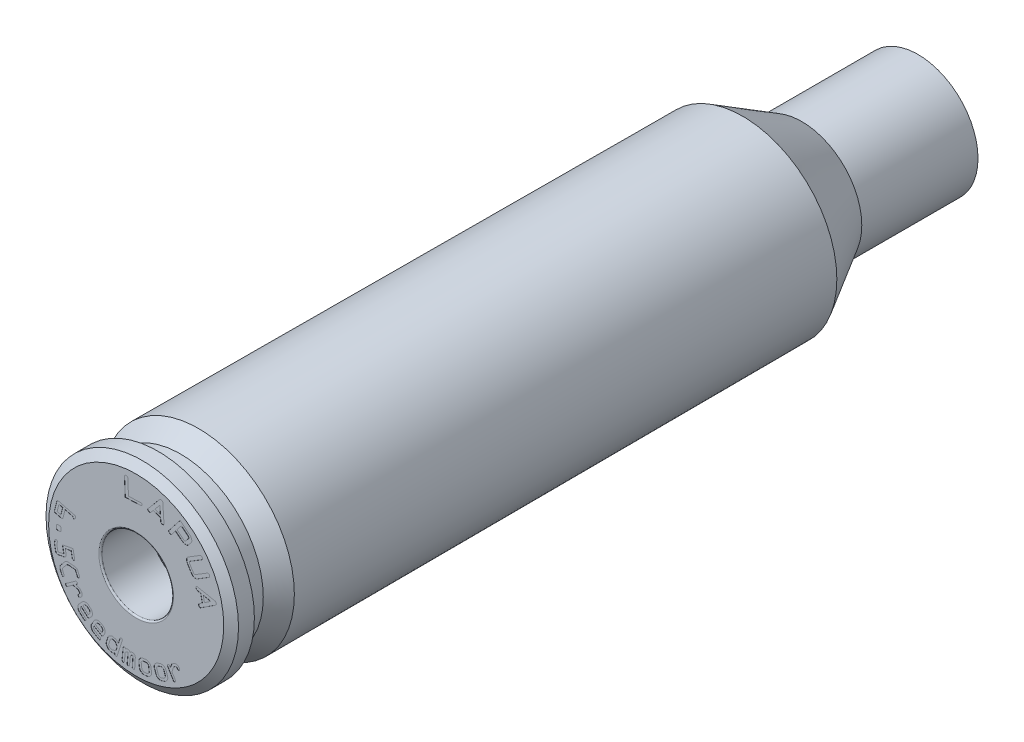
from build123d import *

# Parameters (mm, degrees)
SKETCH4_R          = 2.225
CUT_EXTRUDE1_DEPTH = 3.14
CUT_EXTRUDE2_REACH = 48.414
SKETCH5_R          = 0.75
CUT_EXTRUDE3_DEPTH = 0.01
FILLET1_R          = 0.1


with BuildPart() as part:
    # Sketch2 → case_body (revolve)
    with BuildSketch(Plane(origin=(0, 0, 0), x_dir=(0, 0, -1), z_dir=(1, 0, 0))):
        Polygon((0, 0), (0, 5.462303757), (0.38, 6.005), (1.37, 6.005), (1.37, 5.159), (2.77, 5.159), (3.893127647, 5.975), (37.84, 5.87), (41.520607966, 3.745), (48.77, 3.745), (48.77, 0), align=None)
    revolve(axis=Axis((0, 0, 0), (0, 0, -1)))

    # Sketch3 → Cut-Revolve1 (revolve, cut)
    with BuildSketch(Plane(origin=(0, 0, 0), x_dir=(0, 0, -1), z_dir=(1, 0, 0))):
        Polygon((4.63, 0.36), (4.63, 0), (48.77, 0), (48.77, 0.36), (48.77, 3.385), (48.41, 3.385), (41.424146257, 3.385), (37.743021727, 5.510298238), (4.63, 5.612719081), align=None)
    revolve(axis=Axis((0, 0, 4.130430514), (0, 0, -1)), mode=Mode.SUBTRACT)

    # Sketch4 → Cut-Extrude1 (cut)
    with BuildSketch(Plane.XY):
        Circle(SKETCH4_R)
    extrude(amount=-CUT_EXTRUDE1_DEPTH, mode=Mode.SUBTRACT)

    # Sketch5 → Cut-Extrude2 (cut, up to next)
    with BuildSketch(Plane.XY.offset(-3.14), mode=Mode.PRIVATE) as cut_extrude2_sk1:
        Circle(SKETCH5_R)
    cut_extrude2_tool1 = extrude(cut_extrude2_sk1.sketch, amount=-CUT_EXTRUDE2_REACH, mode=Mode.PRIVATE) & part.part
    add(cut_extrude2_tool1.solids().sort_by_distance((0, 0, -3.14))[0], mode=Mode.SUBTRACT)

    # Sketch6 → Cut-Extrude3 (cut)
    # profile 1 of 17: a face of its own
    with BuildSketch(Plane.XY):
        with BuildLine():
            Line((3.816014045, 1.277100059), (4.919585473, 1.059600059))
            add(Edge.make_bspline(
                [(4.919585473, 1.059600059), (4.924460259, 1.058231153), (4.934033239, 1.055542932), (4.947371584, 1.048972595), (4.959335868, 1.040365668), (4.969533647, 1.029386581), (4.978521578, 1.01661997), (4.985955902, 1.00169624), (4.992181023, 0.984826245), (4.994823957, 0.972677218), (4.996192616, 0.966385773)],
                knots=[0, 0, 0, 0, 0.945514936, 1.856778056, 2.765435591, 3.686896044, 4.646030962, 5.676796436, 6.796915277, 8, 8, 8, 8], degree=3))
            add(Edge.make_bspline(
                [(4.996192616, 0.966385773), (4.99729432, 0.960242535), (4.999391382, 0.948549046), (5.000537112, 0.931476342), (4.999691682, 0.915949616), (4.99755372, 0.901767751), (4.992801884, 0.889261922), (4.986585881, 0.878167499), (4.978827994, 0.868099972), (4.972045426, 0.863113032), (4.96860333, 0.860582202)],
                knots=[0, 0, 0, 0, 1.288657235, 2.452924513, 3.524065652, 4.497375525, 5.401849487, 6.268880567, 7.121471658, 8, 8, 8, 8], degree=3))
            Line((4.96860333, 0.860582202), (4.01610333, 0.238617916))
            add(Edge.make_bspline(
                [(4.01610333, 0.238617916), (4.012600457, 0.236580243), (4.005836462, 0.232645527), (3.998305606, 0.230530493), (3.994674759, 0.229510773)],
                knots=[0, 0, 0, 0, 1.035741137, 2, 2, 2, 2], degree=3))
            add(Edge.make_bspline(
                [(3.994674759, 0.229510773), (3.98958307, 0.228747624), (3.979412928, 0.22722331), (3.963991291, 0.230669832), (3.949126014, 0.237519523), (3.935450101, 0.248432219), (3.923141479, 0.261716216), (3.913053787, 0.277151751), (3.905104982, 0.293968258), (3.9021484, 0.306138929), (3.900656902, 0.31227863)],
                knots=[0, 0, 0, 0, 0.887402713, 1.772498542, 2.695376723, 3.712837195, 4.788445019, 5.829392486, 6.90500031, 8, 8, 8, 8], degree=3))
            add(Edge.make_bspline(
                [(3.900656902, 0.31227863), (3.89955626, 0.318780706), (3.897440055, 0.331282251), (3.896286998, 0.349507435), (3.897263713, 0.366363985), (3.900495367, 0.381683737), (3.905515696, 0.395623055), (3.912883504, 0.407889766), (3.922453841, 0.418606327), (3.930185911, 0.424285688), (3.934139045, 0.427189345)],
                knots=[0, 0, 0, 0, 1.239587734, 2.383355911, 3.426568144, 4.40464042, 5.318483329, 6.199655934, 7.079547764, 8, 8, 8, 8], degree=3))
            Line((3.934139045, 0.427189345), (4.119496188, 0.551742916))
            Line((4.119496188, 0.551742916), (4.024674759, 1.026385773))
            Line((4.024674759, 1.026385773), (3.789764045, 1.074867916))
            add(Edge.make_bspline(
                [(3.789764045, 1.074867916), (3.787210513, 1.075346316), (3.781561632, 1.076404625), (3.7733578, 1.081820885), (3.764998236, 1.090032275), (3.752745933, 1.104332741), (3.739817745, 1.126686914), (3.734574363, 1.146845035), (3.731906902, 1.157100059)],
                knots=[0, 0, 0, 0, 0.440927459, 0.975412253, 1.645523919, 2.44754217, 4.192761043, 6, 6, 6, 6], degree=3))
            add(Edge.make_bspline(
                [(3.731906902, 1.157100059), (3.730690114, 1.164490533), (3.728339656, 1.178766637), (3.728740553, 1.199814674), (3.731749183, 1.219437402), (3.738321399, 1.237132016), (3.747034783, 1.252727893), (3.75868179, 1.264672177), (3.771788101, 1.274012361), (3.7819534, 1.276598159), (3.787085473, 1.27790363)],
                knots=[0, 0, 0, 0, 1.21888685, 2.354511143, 3.417151953, 4.439540361, 5.418294475, 6.303828483, 7.14366749, 8, 8, 8, 8], degree=3))
            add(Edge.make_bspline(
                [(3.787085473, 1.27790363), (3.791733672, 1.278485238), (3.801411719, 1.279696208), (3.811020299, 1.277987897), (3.816014045, 1.277100059)],
                knots=[0, 0, 0, 0, 0.960565358, 2, 2, 2, 2], degree=3))
        make_face()
        Polygon((4.650656902, 0.900225059), (4.188067616, 0.993439345), (4.258246188, 0.642814345), align=None, mode=Mode.SUBTRACT)
    # profile 2 of 17: a face of its own
    with BuildSketch(Plane.XY):
        with BuildLine():
            Line((3.235058301, 2.593772892), (3.998183301, 3.063058606))
            add(Edge.make_bspline(
                [(3.998183301, 3.063058606), (4.002722397, 3.065484555), (4.011835055, 3.070354873), (4.027729097, 3.072573841), (4.044418596, 3.070712525), (4.061688206, 3.065323771), (4.078463016, 3.056473346), (4.09434266, 3.045210902), (4.108146278, 3.030723115), (4.115666259, 3.019518659), (4.119522587, 3.013772892)],
                knots=[0, 0, 0, 0, 0.850243014, 1.706942028, 2.616911344, 3.626540814, 4.695547769, 5.758662556, 6.850617661, 8, 8, 8, 8], degree=3))
            add(Edge.make_bspline(
                [(4.119522587, 3.013772892), (4.122938445, 3.007705218), (4.129560719, 2.995941911), (4.135990889, 2.977000195), (4.13975792, 2.957859635), (4.139416161, 2.938876354), (4.137298562, 2.921023571), (4.131142159, 2.905681272), (4.122608421, 2.892527774), (4.11430581, 2.886753917), (4.110147587, 2.883862177)],
                knots=[0, 0, 0, 0, 1.163266487, 2.25520713, 3.334077563, 4.41025263, 5.422786264, 6.322086516, 7.159645215, 8, 8, 8, 8], degree=3))
            Line((4.110147587, 2.883862177), (3.345683301, 2.413772892))
            add(Edge.make_bspline(
                [(3.345683301, 2.413772892), (3.341729157, 2.410853457), (3.333822855, 2.405016053), (3.325379019, 2.392170468), (3.319755465, 2.37689068), (3.317355036, 2.359308386), (3.317525836, 2.340575636), (3.321173709, 2.321500933), (3.327829119, 2.302675833), (3.334514867, 2.29091535), (3.337915444, 2.284933606)],
                knots=[0, 0, 0, 0, 0.826242275, 1.652069805, 2.555935543, 3.564763353, 4.637877389, 5.713860861, 6.837199237, 8, 8, 8, 8], degree=3))
            Line((3.337915444, 2.284933606), (3.564790444, 1.916362177))
            add(Edge.make_bspline(
                [(3.564790444, 1.916362177), (3.568725069, 1.910425097), (3.576329779, 1.898950112), (3.590281437, 1.884353797), (3.605366743, 1.872253657), (3.621831627, 1.863523347), (3.638455555, 1.858094779), (3.65451421, 1.85629094), (3.669852509, 1.858197409), (3.678729949, 1.862861653), (3.683183301, 1.865201463)],
                knots=[0, 0, 0, 0, 1.199042339, 2.317468029, 3.389839532, 4.447414591, 5.44269777, 6.320698953, 7.157581664, 8, 8, 8, 8], degree=3))
            Line((3.683183301, 1.865201463), (4.446308301, 2.334487177))
            add(Edge.make_bspline(
                [(4.446308301, 2.334487177), (4.450944605, 2.336888988), (4.460192492, 2.341679802), (4.476064901, 2.34427625), (4.492772948, 2.342812939), (4.50977789, 2.3371108), (4.526744007, 2.328907493), (4.542115317, 2.316935837), (4.556460492, 2.30268937), (4.56400914, 2.291165091), (4.567915444, 2.285201463)],
                knots=[0, 0, 0, 0, 0.860117259, 1.715648551, 2.620468594, 3.611737484, 4.669561216, 5.725109833, 6.822781165, 8, 8, 8, 8], degree=3))
            add(Edge.make_bspline(
                [(4.567915444, 2.285201463), (4.571412897, 2.279045622), (4.578235347, 2.26703748), (4.584993387, 2.247854957), (4.58828315, 2.228544039), (4.588196227, 2.209745937), (4.585629348, 2.192073465), (4.579236544, 2.176683632), (4.570162606, 2.163405284), (4.561531617, 2.157466744), (4.557201158, 2.154487177)],
                knots=[0, 0, 0, 0, 1.170116573, 2.282535272, 3.346689013, 4.395961642, 5.384795988, 6.279474455, 7.136754135, 8, 8, 8, 8], degree=3))
            Line((4.557201158, 2.154487177), (3.795415444, 1.686005034))
            add(Edge.make_bspline(
                [(3.795415444, 1.686005034), (3.788738551, 1.682114211), (3.775482177, 1.67438933), (3.753798919, 1.666929041), (3.731570318, 1.661577058), (3.708397361, 1.659533148), (3.684388208, 1.660378001), (3.659599949, 1.664228595), (3.634042286, 1.671026543), (3.608102879, 1.680666637), (3.582268353, 1.692604425), (3.557304061, 1.70689649), (3.533399538, 1.723094268), (3.511165795, 1.741952924), (3.489675197, 1.762073911), (3.46969323, 1.784641537), (3.450991541, 1.809244671), (3.43959081, 1.826821912), (3.433808301, 1.835737177)],
                knots=[0, 0, 0, 0, 0.856753228, 1.701006888, 2.536116736, 3.393042286, 4.276549849, 5.19982814, 6.174452663, 7.210278947, 8.27117485, 9.33318358, 10.403685562, 11.474555287, 12.569333126, 13.672575003, 14.819518205, 16, 16, 16, 16], degree=3))
            Line((3.433808301, 1.835737177), (3.206933301, 2.204308606))
            add(Edge.make_bspline(
                [(3.206933301, 2.204308606), (3.201404762, 2.213502426), (3.190521258, 2.231601416), (3.177376619, 2.259939441), (3.165845059, 2.287966421), (3.157409979, 2.316291238), (3.15082854, 2.344526746), (3.146719212, 2.372933496), (3.145560442, 2.401531769), (3.146201686, 2.429843408), (3.149411893, 2.45717705), (3.1546574, 2.482888493), (3.162423743, 2.506518035), (3.172426788, 2.528159875), (3.184432309, 2.547949921), (3.199075289, 2.565411256), (3.215843564, 2.581023126), (3.228588346, 2.589479811), (3.235058301, 2.593772892)],
                knots=[0, 0, 0, 0, 1.193179957, 2.348898814, 3.47273201, 4.563567012, 5.633930475, 6.697815802, 7.752377617, 8.816123694, 9.846624618, 10.811395621, 11.732171031, 12.60809442, 13.460301966, 14.300077232, 15.137025361, 16, 16, 16, 16], degree=3))
        make_face()
    # profile 3 of 17: a face of its own
    with BuildSketch(Plane.XY):
        with BuildLine():
            Line((2.04207484, 3.433668725), (2.739039125, 4.319472297))
            Line((2.739039125, 4.319472297), (3.327789125, 3.856079439))
            add(Edge.make_bspline(
                [(3.327789125, 3.856079439), (3.33600094, 3.849305776), (3.352153994, 3.835981637), (3.37452994, 3.814558453), (3.394288562, 3.791834429), (3.412470963, 3.768647762), (3.427984995, 3.74406985), (3.441475444, 3.718690283), (3.452391103, 3.692147477), (3.461575181, 3.665195857), (3.467832398, 3.63816938), (3.471838684, 3.61201611), (3.472591883, 3.587032974), (3.470840039, 3.563094067), (3.465976924, 3.54032732), (3.458423367, 3.51859865), (3.448001259, 3.498091775), (3.438946113, 3.485699109), (3.434396268, 3.479472297)],
                knots=[0, 0, 0, 0, 1.182666851, 2.326365311, 3.43701111, 4.526450378, 5.597069835, 6.66215872, 7.716099398, 8.782804328, 9.82240501, 10.79473587, 11.717889913, 12.593715691, 13.455721312, 14.296629434, 15.144125242, 16, 16, 16, 16], degree=3))
            Line((3.434396268, 3.479472297), (3.258146268, 3.255543725))
            add(Edge.make_bspline(
                [(3.258146268, 3.255543725), (3.25309838, 3.249704551), (3.243080342, 3.238116127), (3.225868242, 3.223061721), (3.206787589, 3.21047892), (3.185801968, 3.200694285), (3.163185165, 3.193050834), (3.138757052, 3.188442245), (3.112684633, 3.18562025), (3.085147145, 3.185829348), (3.056915824, 3.188146546), (3.028824055, 3.193085846), (3.000954051, 3.199920107), (2.973687776, 3.209830243), (2.946452489, 3.221416023), (2.9200061, 3.236192644), (2.893547732, 3.252691845), (2.876714222, 3.2654098), (2.868146268, 3.271883011)],
                knots=[0, 0, 0, 0, 0.858472531, 1.703724514, 2.536258132, 3.3943278, 4.27439335, 5.186648174, 6.15587274, 7.189562773, 8.246922214, 9.305775497, 10.361638983, 11.436741603, 12.531737938, 13.652592658, 14.805211832, 16, 16, 16, 16], degree=3))
            Line((2.868146268, 3.271883011), (2.447342697, 3.602954439))
            Line((2.447342697, 3.602954439), (2.210021268, 3.301347297))
            add(Edge.make_bspline(
                [(2.210021268, 3.301347297), (2.206545424, 3.297551655), (2.199592147, 3.289958637), (2.185603035, 3.282483886), (2.169691008, 3.278091817), (2.15199644, 3.277597871), (2.133509408, 3.279903213), (2.114993924, 3.285739655), (2.0968062, 3.294652314), (2.085622496, 3.302774636), (2.079842697, 3.306972297)],
                knots=[0, 0, 0, 0, 0.853122285, 1.706634509, 2.602746846, 3.586758621, 4.637912851, 5.6978934, 6.810258684, 8, 8, 8, 8], degree=3))
            add(Edge.make_bspline(
                [(2.079842697, 3.306972297), (2.07432581, 3.311631322), (2.063567296, 3.320716916), (2.050503243, 3.336708339), (2.039996824, 3.353548981), (2.032809647, 3.37119542), (2.029204078, 3.388861175), (2.029348953, 3.40549845), (2.033209405, 3.420998652), (2.039112036, 3.429434422), (2.04207484, 3.433668725)],
                knots=[0, 0, 0, 0, 1.184667838, 2.31022763, 3.377442293, 4.437569786, 5.424792984, 6.320145885, 7.156803447, 8, 8, 8, 8], degree=3))
        make_face()
        with BuildLine():
            Line((2.541628411, 3.722686582), (2.962431982, 3.391615154))
            add(Edge.make_bspline(
                [(2.962431982, 3.391615154), (2.968026187, 3.387495109), (2.978903612, 3.379484054), (2.99691111, 3.370892813), (3.015312552, 3.365169157), (3.03394441, 3.362385526), (3.051789771, 3.363081874), (3.067967971, 3.367045308), (3.081907974, 3.374624173), (3.088864986, 3.38220207), (3.092342697, 3.385990154)],
                knots=[0, 0, 0, 0, 1.160374152, 2.256242838, 3.319545998, 4.376004352, 5.392951844, 6.288015883, 7.144203522, 8, 8, 8, 8], degree=3))
            Line((3.092342697, 3.385990154), (3.268592697, 3.609918725))
            add(Edge.make_bspline(
                [(3.268592697, 3.609918725), (3.271410056, 3.614173725), (3.277061671, 3.622709242), (3.281507834, 3.638025585), (3.281084495, 3.654749597), (3.277512258, 3.672277922), (3.271038332, 3.689949879), (3.26105266, 3.706571172), (3.248447783, 3.721978653), (3.238201837, 3.730779802), (3.232967697, 3.735275868)],
                knots=[0, 0, 0, 0, 0.850045489, 1.705188552, 2.615867919, 3.620125118, 4.687743453, 5.745188269, 6.84812964, 8, 8, 8, 8], degree=3))
            Line((3.232967697, 3.735275868), (2.812164125, 4.066347297))
            Line((2.812164125, 4.066347297), (2.541628411, 3.722686582))
        make_face(mode=Mode.SUBTRACT)
    # profile 4 of 17: a face of its own
    with BuildSketch(Plane.XY):
        with BuildLine():
            Line((0.737205576, 3.956091269), (1.462294862, 4.815912698))
            add(Edge.make_bspline(
                [(1.462294862, 4.815912698), (1.465839779, 4.819613547), (1.472715717, 4.826791938), (1.484885332, 4.835295203), (1.498086104, 4.841555417), (1.51254336, 4.845244132), (1.527975128, 4.84684079), (1.544525183, 4.846159498), (1.562196325, 4.843593927), (1.574029477, 4.84000287), (1.580152004, 4.838144841)],
                knots=[0, 0, 0, 0, 0.961234778, 1.864469465, 2.772834002, 3.692750903, 4.654571443, 5.678782591, 6.798991317, 8, 8, 8, 8], degree=3))
            add(Edge.make_bspline(
                [(1.580152004, 4.838144841), (1.585992889, 4.836101241), (1.59715051, 4.832197428), (1.612608495, 4.82502089), (1.625703211, 4.816649465), (1.636984056, 4.807816581), (1.646083731, 4.797865331), (1.652346152, 4.786656683), (1.657373895, 4.774956527), (1.658387463, 4.766589047), (1.658902004, 4.762341269)],
                knots=[0, 0, 0, 0, 1.277295343, 2.439969088, 3.508837716, 4.479046853, 5.39298418, 6.268756583, 7.12112888, 8, 8, 8, 8], degree=3))
            Line((1.658902004, 4.762341269), (1.73711629, 3.627430555))
            add(Edge.make_bspline(
                [(1.73711629, 3.627430555), (1.7373224, 3.623303492), (1.73771568, 3.615428589), (1.735857691, 3.60777127), (1.734973433, 3.604126984)],
                knots=[0, 0, 0, 0, 1.048155963, 2, 2, 2, 2], degree=3))
            add(Edge.make_bspline(
                [(1.734973433, 3.604126984), (1.733084575, 3.599343353), (1.729346138, 3.589875569), (1.719051083, 3.577911349), (1.705594768, 3.568619284), (1.689634255, 3.561393799), (1.6719551, 3.557457257), (1.653740147, 3.555595526), (1.635230842, 3.557277931), (1.62323481, 3.560631035), (1.61711629, 3.562341269)],
                knots=[0, 0, 0, 0, 0.889922967, 1.761339545, 2.697023954, 3.719396752, 4.789765946, 5.835027038, 6.89576583, 8, 8, 8, 8], degree=3))
            add(Edge.make_bspline(
                [(1.61711629, 3.562341269), (1.610923059, 3.564572248), (1.599056796, 3.568846816), (1.582487803, 3.576435381), (1.568561791, 3.585737628), (1.556402156, 3.595546936), (1.547039868, 3.60693331), (1.539763527, 3.61925021), (1.535231577, 3.632785115), (1.53393238, 3.642223145), (1.533277004, 3.646984127)],
                knots=[0, 0, 0, 0, 1.244203024, 2.383899555, 3.432246993, 4.402304135, 5.324821487, 6.20176956, 7.092888846, 8, 8, 8, 8], degree=3))
            Line((1.533277004, 3.646984127), (1.515062719, 3.869841269))
            Line((1.515062719, 3.869841269), (1.056759147, 4.016894841))
            Line((1.056759147, 4.016894841), (0.900598433, 3.835019841))
            add(Edge.make_bspline(
                [(0.900598433, 3.835019841), (0.898908961, 3.833033883), (0.895131134, 3.828593082), (0.886446306, 3.823975181), (0.875141208, 3.820689533), (0.856714884, 3.817132025), (0.83096762, 3.816481652), (0.810881096, 3.821671729), (0.800687719, 3.824305555)],
                knots=[0, 0, 0, 0, 0.443530723, 0.991779, 1.649605818, 2.459474707, 4.203277573, 6, 6, 6, 6], degree=3))
            add(Edge.make_bspline(
                [(0.800687719, 3.824305555), (0.793703573, 3.826746215), (0.780167455, 3.831476508), (0.762281311, 3.842248324), (0.746463061, 3.854204955), (0.734313371, 3.86869834), (0.725372531, 3.88402046), (0.720316943, 3.899823263), (0.718941653, 3.915818565), (0.721468303, 3.92603385), (0.72274129, 3.931180555)],
                knots=[0, 0, 0, 0, 1.207717679, 2.340702532, 3.402048392, 4.438758144, 5.414001982, 6.287583376, 7.137243463, 8, 8, 8, 8], degree=3))
            add(Edge.make_bspline(
                [(0.72274129, 3.931180555), (0.724424791, 3.935486947), (0.727959709, 3.944529261), (0.734027542, 3.95211712), (0.737205576, 3.956091269)],
                knots=[0, 0, 0, 0, 0.952497665, 2, 2, 2, 2], degree=3))
        make_face()
        Polygon((1.470062719, 4.503591269), (1.164705576, 4.143859127), (1.503277004, 4.035109127), align=None, mode=Mode.SUBTRACT)
    # profile 5 of 17: a face of its own
    with BuildSketch(Plane.XY):
        with BuildLine():
            Line((-0.684084804, 3.859482333), (-0.733370518, 4.985018047))
            add(Edge.make_bspline(
                [(-0.733370518, 4.985018047), (-0.733214556, 4.990069762), (-0.732901453, 5.000211403), (-0.727055155, 5.014756178), (-0.717590603, 5.028356909), (-0.704107904, 5.040200901), (-0.688466232, 5.050853361), (-0.670654919, 5.058647972), (-0.651432489, 5.063960473), (-0.637960092, 5.06489553), (-0.63104909, 5.06537519)],
                knots=[0, 0, 0, 0, 0.841261264, 1.688885767, 2.581287853, 3.597891222, 4.676888418, 5.741892413, 6.841647386, 8, 8, 8, 8], degree=3))
            add(Edge.make_bspline(
                [(-0.63104909, 5.06537519), (-0.624166953, 5.065377927), (-0.610674855, 5.065383291), (-0.590945024, 5.062315435), (-0.572704564, 5.055578188), (-0.556139654, 5.046724489), (-0.54189146, 5.035953671), (-0.531031412, 5.023488884), (-0.524193525, 5.009367217), (-0.522928829, 4.999370689), (-0.52229909, 4.994393047)],
                knots=[0, 0, 0, 0, 1.155363827, 2.265035031, 3.332543471, 4.406356148, 5.41144571, 6.316038752, 7.161493173, 8, 8, 8, 8], degree=3))
            Line((-0.52229909, 4.994393047), (-0.479709804, 4.020732333))
            Line((-0.479709804, 4.020732333), (0.266004482, 4.053143047))
            add(Edge.make_bspline(
                [(0.266004482, 4.053143047), (0.273067177, 4.053152601), (0.286918071, 4.053171336), (0.307114567, 4.05000958), (0.325859187, 4.043692867), (0.342840301, 4.035052104), (0.357273818, 4.024247813), (0.368474936, 4.011765768), (0.375585343, 3.997447452), (0.376820065, 3.987232301), (0.377433053, 3.982160905)],
                knots=[0, 0, 0, 0, 1.164144034, 2.283042722, 3.354483895, 4.415238378, 5.414036569, 6.312040728, 7.161998585, 8, 8, 8, 8], degree=3))
            add(Edge.make_bspline(
                [(0.377433053, 3.982160905), (0.377290682, 3.976931978), (0.377009773, 3.96661488), (0.371122249, 3.95166734), (0.361127785, 3.938235911), (0.347711636, 3.926035145), (0.331546819, 3.915804531), (0.313419243, 3.90788522), (0.293547887, 3.903108686), (0.279778213, 3.901892923), (0.27270091, 3.901268047)],
                knots=[0, 0, 0, 0, 0.855284081, 1.687544925, 2.59273067, 3.590907545, 4.654617228, 5.727218255, 6.831841294, 8, 8, 8, 8], degree=3))
            Line((0.27270091, 3.901268047), (-0.684084804, 3.859482333))
        make_face()
    # profile 6 of 17: a face of its own
    with BuildSketch(Plane.XY):
        with BuildLine():
            Line((-3.783365914, 1.225379745), (-3.802115914, 1.151451174))
            add(Edge.make_bspline(
                [(-3.802115914, 1.151451174), (-3.803611558, 1.146546131), (-3.806536569, 1.136953407), (-3.814376314, 1.124009214), (-3.824613146, 1.112891314), (-3.837255812, 1.10422183), (-3.850931445, 1.097790024), (-3.865380669, 1.094240733), (-3.880184137, 1.093168937), (-3.889905369, 1.095234011), (-3.894794485, 1.096272602)],
                knots=[0, 0, 0, 0, 1.024593387, 2.003782749, 3.004331695, 4.032202791, 5.057265064, 6.016624035, 7.00249736, 8, 8, 8, 8], degree=3))
            add(Edge.make_bspline(
                [(-3.894794485, 1.096272602), (-3.899702796, 1.097764449), (-3.90930191, 1.100682033), (-3.922147615, 1.108544234), (-3.933355919, 1.118469088), (-3.942008421, 1.130874082), (-3.948588025, 1.144500387), (-3.95201544, 1.15901666), (-3.952699551, 1.174070086), (-3.950724929, 1.183883403), (-3.9497052, 1.188951174)],
                knots=[0, 0, 0, 0, 1.023504479, 2.001653185, 2.98907211, 4.00127027, 5.009037272, 6.002105554, 6.968251982, 8, 8, 8, 8], degree=3))
            Line((-3.9497052, 1.188951174), (-4.437740914, 1.312433317))
            Line((-4.437740914, 1.312433317), (-4.569526628, 0.791986888))
            add(Edge.make_bspline(
                [(-4.569526628, 0.791986888), (-4.571036032, 0.787264932), (-4.574013648, 0.777949878), (-4.581782002, 0.765319045), (-4.592214698, 0.754418652), (-4.604924352, 0.745581659), (-4.618899657, 0.738751635), (-4.633705362, 0.735377476), (-4.648835112, 0.734246094), (-4.658743085, 0.73629549), (-4.663812342, 0.737344031)],
                knots=[0, 0, 0, 0, 0.983916532, 1.940982816, 2.921522877, 3.966919439, 5.008380804, 5.995502284, 6.97443041, 8, 8, 8, 8], degree=3))
            Line((-4.663812342, 0.737344031), (-5.045240914, 0.83404046))
            add(Edge.make_bspline(
                [(-5.045240914, 0.83404046), (-5.050159556, 0.835513858), (-5.059823425, 0.838408708), (-5.072497877, 0.846540127), (-5.083626361, 0.856613612), (-5.092246589, 0.869249532), (-5.098749437, 0.883169163), (-5.101873875, 0.89797715), (-5.102636906, 0.913085777), (-5.100638684, 0.922989297), (-5.099615914, 0.928058317)],
                knots=[0, 0, 0, 0, 1.016269552, 1.99670863, 2.964041158, 3.98356179, 5.016442174, 5.998487214, 6.97554518, 8, 8, 8, 8], degree=3))
            Line((-5.099615914, 0.928058317), (-4.949615914, 1.520558317))
            add(Edge.make_bspline(
                [(-4.949615914, 1.520558317), (-4.948145331, 1.525478852), (-4.945256013, 1.535146439), (-4.937048271, 1.547849802), (-4.927001831, 1.559199278), (-4.914508865, 1.568313355), (-4.900761929, 1.575265356), (-4.886327164, 1.579480857), (-4.871477488, 1.580343012), (-4.861827923, 1.578530502), (-4.856937342, 1.577611888)],
                knots=[0, 0, 0, 0, 1.019546907, 2.003147791, 2.986748675, 4.030432941, 5.06587867, 6.046896224, 7.010130495, 8, 8, 8, 8], degree=3))
            Line((-4.856937342, 1.577611888), (-3.838276628, 1.31966546))
            add(Edge.make_bspline(
                [(-3.838276628, 1.31966546), (-3.83337177, 1.318169788), (-3.823779408, 1.315244723), (-3.810832573, 1.307405371), (-3.799724924, 1.297167018), (-3.791015963, 1.284530207), (-3.784647132, 1.270655308), (-3.780554117, 1.255994843), (-3.780490456, 1.240606044), (-3.782392585, 1.230533775), (-3.783365914, 1.225379745)],
                knots=[0, 0, 0, 0, 1.010854908, 1.9769146, 2.964047472, 3.978136139, 4.989453645, 5.974531141, 6.963557492, 8, 8, 8, 8], degree=3))
        make_face()
        Polygon((-4.586401628, 1.352076174), (-4.820240914, 1.411272602), (-4.933276628, 0.964754745), (-4.699437342, 0.905558317), align=None, mode=Mode.SUBTRACT)
    # profile 7 of 17: a face of its own
    with BuildSketch(Plane.XY):
        with BuildLine():
            Line((-4.687127552, 0.195668758), (-4.691413266, 0.042186615))
            add(Edge.make_bspline(
                [(-4.691413266, 0.042186615), (-4.691846216, 0.037241677), (-4.692706374, 0.027417387), (-4.697382984, 0.013363446), (-4.704804541, 0.000387905), (-4.715000586, -0.010884276), (-4.726766698, -0.020456637), (-4.740009855, -0.027467662), (-4.754504449, -0.031259923), (-4.764517287, -0.031579072), (-4.769627552, -0.031741957)],
                knots=[0, 0, 0, 0, 0.995741209, 1.978275933, 2.951741165, 3.982341821, 5.017314742, 5.989287818, 6.973790237, 8, 8, 8, 8], degree=3))
            Line((-4.769627552, -0.031741957), (-4.898734695, -0.027991957))
            add(Edge.make_bspline(
                [(-4.898734695, -0.027991957), (-4.903863737, -0.027581316), (-4.913878902, -0.026779482), (-4.928209132, -0.021902387), (-4.941472505, -0.014692807), (-4.953182205, -0.004669618), (-4.963106126, 0.0070569), (-4.969842818, 0.02060148), (-4.974156307, 0.035044245), (-4.974409399, 0.045101476), (-4.974538266, 0.050222329)],
                knots=[0, 0, 0, 0, 1.018544249, 1.988848498, 2.981111376, 4.000735981, 5.033998068, 6.009636808, 6.986564372, 8, 8, 8, 8], degree=3))
            Line((-4.974538266, 0.050222329), (-4.970252552, 0.205579472))
            add(Edge.make_bspline(
                [(-4.970252552, 0.205579472), (-4.969865201, 0.210715931), (-4.969106694, 0.220774106), (-4.963931086, 0.234876071), (-4.956689493, 0.247894741), (-4.946373313, 0.258926197), (-4.934510192, 0.268297467), (-4.921255529, 0.275121893), (-4.906905429, 0.279044184), (-4.897062327, 0.279351292), (-4.892038266, 0.279508043)],
                knots=[0, 0, 0, 0, 1.0316982, 2.020263319, 2.994026261, 4.011549945, 5.035712817, 6.023951408, 6.991396545, 8, 8, 8, 8], degree=3))
            Line((-4.892038266, 0.279508043), (-4.761056124, 0.275758043))
            add(Edge.make_bspline(
                [(-4.761056124, 0.275758043), (-4.755933223, 0.275335777), (-4.745930051, 0.274511243), (-4.731618696, 0.26983415), (-4.718838027, 0.262115482), (-4.707604998, 0.251888449), (-4.698348057, 0.239718758), (-4.691448162, 0.22614746), (-4.687580469, 0.211238998), (-4.68728143, 0.200958734), (-4.687127552, 0.195668758)],
                knots=[0, 0, 0, 0, 1.016186058, 1.984243805, 2.952301553, 3.954526217, 4.977315442, 5.966489954, 6.953604839, 8, 8, 8, 8], degree=3))
        make_face()
    # profile 8 of 17: a face of its own
    with BuildSketch(Plane.XY):
        with BuildLine():
            Line((-4.946655627, -0.83905723), (-4.881298484, -1.18405723))
            Line((-4.881298484, -1.18405723), (-4.515673484, -1.11468223))
            Line((-4.515673484, -1.11468223), (-4.601119913, -0.663878658))
            Line((-4.601119913, -0.663878658), (-3.938441341, -0.538789372))
            Line((-3.938441341, -0.538789372), (-3.839066341, -1.06405723))
            add(Edge.make_bspline(
                [(-3.839066341, -1.06405723), (-3.838429944, -1.069047975), (-3.837190967, -1.078764279), (-3.838580476, -1.093580086), (-3.84321222, -1.107797693), (-3.85075337, -1.121044299), (-3.860283077, -1.132823609), (-3.871671712, -1.142397444), (-3.884823649, -1.149370873), (-3.894441347, -1.151589336), (-3.899334198, -1.152717944)],
                knots=[0, 0, 0, 0, 1.01276911, 1.971723875, 2.974349743, 4.006635114, 5.03071509, 6.015544833, 6.990439926, 8, 8, 8, 8], degree=3))
            add(Edge.make_bspline(
                [(-3.899334198, -1.152717944), (-3.904411959, -1.153347146), (-3.914302327, -1.154572695), (-3.929243224, -1.153298438), (-3.943326099, -1.148440413), (-3.956620328, -1.141416708), (-3.968213332, -1.131730001), (-3.9773212, -1.120059773), (-3.984404724, -1.106865022), (-3.986775765, -1.097168175), (-3.987994913, -1.09218223)],
                knots=[0, 0, 0, 0, 1.028005064, 2.002329127, 2.985228991, 4.006144824, 5.013693975, 5.998562265, 6.970896556, 8, 8, 8, 8], degree=3))
            Line((-3.987994913, -1.09218223), (-4.058709198, -0.717985801))
            Line((-4.058709198, -0.717985801), (-4.423530627, -0.786825087))
            Line((-4.423530627, -0.786825087), (-4.366744913, -1.08655723))
            add(Edge.make_bspline(
                [(-4.366744913, -1.08655723), (-4.36542391, -1.096453394), (-4.362826693, -1.11591019), (-4.36637686, -1.145335616), (-4.375716504, -1.17369541), (-4.390641322, -1.200322124), (-4.409816794, -1.22401353), (-4.432799297, -1.242882922), (-4.458806976, -1.256884745), (-4.477850585, -1.261518787), (-4.487548484, -1.263878658)],
                knots=[0, 0, 0, 0, 1.005644104, 1.977191404, 2.964491968, 4.006557681, 5.045219028, 6.026107541, 6.994801292, 8, 8, 8, 8], degree=3))
            Line((-4.487548484, -1.263878658), (-4.853173484, -1.333253658))
            add(Edge.make_bspline(
                [(-4.853173484, -1.333253658), (-4.8631536, -1.33453718), (-4.882768857, -1.337059858), (-4.912354609, -1.334071337), (-4.940500748, -1.324452736), (-4.96704525, -1.309958602), (-4.990346137, -1.290597939), (-5.00940922, -1.267661214), (-5.023158586, -1.241224479), (-5.027848084, -1.221956718), (-5.030227055, -1.21218223)],
                knots=[0, 0, 0, 0, 1.01287391, 1.990736731, 2.967769448, 3.995790497, 5.025704046, 6.004893571, 6.987887393, 8, 8, 8, 8], degree=3))
            Line((-5.030227055, -1.21218223), (-5.095584198, -0.86718223))
            add(Edge.make_bspline(
                [(-5.095584198, -0.86718223), (-5.096882309, -0.85925422), (-5.09953924, -0.843027428), (-5.099244677, -0.817771941), (-5.09775449, -0.791275279), (-5.094201626, -0.773492941), (-5.092369913, -0.764325087)],
                knots=[0, 0, 0, 0, 0.929129744, 1.901712589, 2.918207786, 4, 4, 4, 4], degree=3))
            Line((-5.092369913, -0.764325087), (-5.06638777, -0.642717944))
            add(Edge.make_bspline(
                [(-5.06638777, -0.642717944), (-5.064256885, -0.635196155), (-5.060166048, -0.620755949), (-5.046533992, -0.602561188), (-5.027123259, -0.589976374), (-5.012005603, -0.586110358), (-5.003977055, -0.58405723)],
                knots=[0, 0, 0, 0, 1.020660501, 1.959446987, 2.916321548, 4, 4, 4, 4], degree=3))
            add(Edge.make_bspline(
                [(-5.003977055, -0.58405723), (-4.998898279, -0.583302659), (-4.989013999, -0.58183412), (-4.974242776, -0.58333775), (-4.960260519, -0.587440512), (-4.947302949, -0.59411205), (-4.935685457, -0.602848698), (-4.926523339, -0.613671659), (-4.919721072, -0.626162782), (-4.917520642, -0.635323207), (-4.91638777, -0.640039372)],
                knots=[0, 0, 0, 0, 1.062527872, 2.067884526, 3.053389279, 4.073170725, 5.078014485, 6.051237232, 6.996696493, 8, 8, 8, 8], degree=3))
            add(Edge.make_bspline(
                [(-4.91638777, -0.640039372), (-4.915551296, -0.648273259), (-4.913713281, -0.666365897), (-4.917525022, -0.684174616), (-4.919602055, -0.693878658)],
                knots=[0, 0, 0, 0, 0.910191949, 2, 2, 2, 2], degree=3))
            Line((-4.919602055, -0.693878658), (-4.942905627, -0.800485801))
            add(Edge.make_bspline(
                [(-4.942905627, -0.800485801), (-4.944885569, -0.806960427), (-4.948742697, -0.819573655), (-4.94733885, -0.832679084), (-4.946655627, -0.83905723)],
                knots=[0, 0, 0, 0, 1.026640566, 2, 2, 2, 2], degree=3))
        make_face()
    # profile 9 of 17: a face of its own
    with BuildSketch(Plane.XY):
        with BuildLine():
            Line((-4.603540825, -1.998502792), (-4.496933683, -2.249484935))
            add(Edge.make_bspline(
                [(-4.496933683, -2.249484935), (-4.495243063, -2.25425773), (-4.491896735, -2.26370476), (-4.489932492, -2.278661089), (-4.491446807, -2.293768375), (-4.495662884, -2.308456514), (-4.502361706, -2.322159213), (-4.51119295, -2.334248125), (-4.522774913, -2.34385182), (-4.531739735, -2.348233793), (-4.536308683, -2.350467078)],
                knots=[0, 0, 0, 0, 1.009098924, 1.997359927, 2.981755486, 4.019875702, 5.032275169, 6.012628019, 6.987129905, 8, 8, 8, 8], degree=3))
            add(Edge.make_bspline(
                [(-4.536308683, -2.350467078), (-4.541074197, -2.352213291), (-4.550404739, -2.355632251), (-4.565356505, -2.356820722), (-4.580265325, -2.355196082), (-4.594880074, -2.350611435), (-4.608453662, -2.343585592), (-4.619967342, -2.333855068), (-4.629562397, -2.322283002), (-4.633982279, -2.313252262), (-4.636219397, -2.308681364)],
                knots=[0, 0, 0, 0, 1.010077398, 1.977660218, 2.96478556, 3.991895396, 5.021481692, 5.996928504, 6.986147774, 8, 8, 8, 8], degree=3))
            Line((-4.636219397, -2.308681364), (-4.74657654, -2.048592078))
            add(Edge.make_bspline(
                [(-4.74657654, -2.048592078), (-4.749682086, -2.040003929), (-4.756031917, -2.022443959), (-4.761001859, -1.994062475), (-4.761812985, -1.963732268), (-4.759502562, -1.932385011), (-4.753782132, -1.90174191), (-4.745215555, -1.873836138), (-4.734610514, -1.849053956), (-4.724431125, -1.835308809), (-4.719522968, -1.828681364)],
                knots=[0, 0, 0, 0, 0.9500441, 1.942530926, 2.984929915, 4.104209127, 5.211521251, 6.223601647, 7.14348083, 8, 8, 8, 8], degree=3))
            Line((-4.719522968, -1.828681364), (-4.477112254, -1.535913507))
            add(Edge.make_bspline(
                [(-4.477112254, -1.535913507), (-4.468021029, -1.526248231), (-4.450103612, -1.507199446), (-4.420086933, -1.48235373), (-4.387848792, -1.461527109), (-4.36483585, -1.450750635), (-4.353362254, -1.445377792)],
                knots=[0, 0, 0, 0, 1.029427618, 2.028844862, 3.017238251, 4, 4, 4, 4], degree=3))
            add(Edge.make_bspline(
                [(-4.353362254, -1.445377792), (-4.340593543, -1.440474039), (-4.315789426, -1.430948153), (-4.27802614, -1.421330208), (-4.241037177, -1.4171472), (-4.216848984, -1.418116181), (-4.204969397, -1.418592078)],
                knots=[0, 0, 0, 0, 1.077715536, 2.093538075, 3.063676166, 4, 4, 4, 4], degree=3))
            Line((-4.204969397, -1.418592078), (-3.828897968, -1.450734935))
            add(Edge.make_bspline(
                [(-3.828897968, -1.450734935), (-3.820013281, -1.451929702), (-3.801879033, -1.454368301), (-3.774979215, -1.462577004), (-3.748322696, -1.475000036), (-3.722173457, -1.490145498), (-3.697755335, -1.507553507), (-3.677370002, -1.527243964), (-3.660545042, -1.54797461), (-3.653089792, -1.563425543), (-3.649433683, -1.571002792)],
                knots=[0, 0, 0, 0, 0.955333147, 1.949899748, 2.985851571, 4.087109011, 5.171300027, 6.175175638, 7.105092848, 8, 8, 8, 8], degree=3))
            Line((-3.649433683, -1.571002792), (-3.532647968, -1.846359935))
            add(Edge.make_bspline(
                [(-3.532647968, -1.846359935), (-3.530932991, -1.851128991), (-3.527572117, -1.860474999), (-3.525938921, -1.875386029), (-3.527632208, -1.890245286), (-3.532271249, -1.90461042), (-3.539050676, -1.917997846), (-3.548353163, -1.929376426), (-3.5595329, -1.938884617), (-3.568335763, -1.94306606), (-3.57282654, -1.945199221)],
                knots=[0, 0, 0, 0, 1.024638412, 2.008003515, 3.009358999, 4.033997411, 5.053989639, 6.032010327, 6.996030859, 8, 8, 8, 8], degree=3))
            add(Edge.make_bspline(
                [(-3.57282654, -1.945199221), (-3.577689604, -1.946885066), (-3.587152544, -1.950165519), (-3.602177904, -1.952226457), (-3.617173564, -1.950669223), (-3.631889916, -1.946726914), (-3.645580899, -1.940151902), (-3.657154045, -1.930831642), (-3.667027767, -1.919633331), (-3.671332011, -1.910684408), (-3.673540825, -1.906092078)],
                knots=[0, 0, 0, 0, 1.028911475, 2.002138382, 3.007017928, 4.025945792, 5.041104491, 6.020874173, 6.984369391, 8, 8, 8, 8], degree=3))
            Line((-3.673540825, -1.906092078), (-3.786040825, -1.640913507))
            add(Edge.make_bspline(
                [(-3.786040825, -1.640913507), (-3.788762965, -1.635762939), (-3.794234131, -1.625410932), (-3.808620073, -1.613858399), (-3.826994038, -1.606243176), (-3.840779489, -1.604576525), (-3.848183683, -1.603681364)],
                knots=[0, 0, 0, 0, 0.908026764, 1.825022178, 2.831815034, 4, 4, 4, 4], degree=3))
            Line((-3.848183683, -1.603681364), (-4.201755111, -1.571806364))
            add(Edge.make_bspline(
                [(-4.201755111, -1.571806364), (-4.208816538, -1.571392622), (-4.223170793, -1.570551579), (-4.24509109, -1.573740777), (-4.267644727, -1.578834505), (-4.282353844, -1.584639614), (-4.289880111, -1.587609935)],
                knots=[0, 0, 0, 0, 0.936693681, 1.90408255, 2.927574235, 4, 4, 4, 4], degree=3))
            add(Edge.make_bspline(
                [(-4.289880111, -1.587609935), (-4.297766911, -1.591142126), (-4.313148825, -1.598031085), (-4.333730371, -1.611788429), (-4.352370158, -1.626582863), (-4.362543822, -1.638334907), (-4.367558683, -1.644127792)],
                knots=[0, 0, 0, 0, 1.067070519, 2.081146545, 3.054147685, 4, 4, 4, 4], degree=3))
            Line((-4.367558683, -1.644127792), (-4.588540825, -1.911984935))
            add(Edge.make_bspline(
                [(-4.588540825, -1.911984935), (-4.593747395, -1.918411568), (-4.603669095, -1.930658234), (-4.6106502, -1.952961634), (-4.611612322, -1.976213584), (-4.60631822, -1.990833095), (-4.603540825, -1.998502792)],
                knots=[0, 0, 0, 0, 1.056961028, 2.014157445, 2.95818608, 4, 4, 4, 4], degree=3))
        make_face()
    # profile 10 of 17: a face of its own
    with BuildSketch(Plane.XY):
        with BuildLine():
            Line((-4.374275156, -2.636561696), (-3.787132299, -2.221115267))
            add(Edge.make_bspline(
                [(-3.787132299, -2.221115267), (-3.782857707, -2.218332474), (-3.77445201, -2.212860299), (-3.760142384, -2.208034779), (-3.745208622, -2.206133744), (-3.729952347, -2.207308343), (-3.715175635, -2.210979113), (-3.701376705, -2.21706799), (-3.689636302, -2.226486974), (-3.683419111, -2.234289882), (-3.680257299, -2.238258124)],
                knots=[0, 0, 0, 0, 1.014823736, 1.995582159, 2.98376212, 4.002179269, 5.030992658, 6.011913016, 6.98893953, 8, 8, 8, 8], degree=3))
            add(Edge.make_bspline(
                [(-3.680257299, -2.238258124), (-3.677487361, -2.242627216), (-3.672080425, -2.251155709), (-3.667129243, -2.265403236), (-3.665560483, -2.280305512), (-3.666987178, -2.295363156), (-3.670847553, -2.310066584), (-3.677696797, -2.32348172), (-3.687314873, -2.335329334), (-3.695385687, -2.341623238), (-3.699543014, -2.344865267)],
                knots=[0, 0, 0, 0, 1.025894087, 2.00255144, 2.966874307, 3.982429722, 4.994256035, 5.970590793, 6.954638651, 8, 8, 8, 8], degree=3))
            Line((-3.699543014, -2.344865267), (-3.776953728, -2.399775982))
            Line((-3.776953728, -2.399775982), (-3.619185871, -2.439686696))
            add(Edge.make_bspline(
                [(-3.619185871, -2.439686696), (-3.611306628, -2.441930427), (-3.596039792, -2.446277885), (-3.574143083, -2.453892569), (-3.554291832, -2.463287053), (-3.535672218, -2.472926672), (-3.519020375, -2.484245545), (-3.504292192, -2.496696087), (-3.490810335, -2.509807482), (-3.483353505, -2.519673794), (-3.479632299, -2.52459741)],
                knots=[0, 0, 0, 0, 1.179366515, 2.285142841, 3.331825445, 4.338115046, 5.300606207, 6.222151211, 7.112794552, 8, 8, 8, 8], degree=3))
            Line((-3.479632299, -2.52459741), (-3.415614442, -2.615133124))
            add(Edge.make_bspline(
                [(-3.415614442, -2.615133124), (-3.411257749, -2.621465427), (-3.402640898, -2.633989719), (-3.392668453, -2.654204005), (-3.38446634, -2.674680393), (-3.378515624, -2.695776362), (-3.374835787, -2.717413524), (-3.373117873, -2.739573837), (-3.37404639, -2.762188956), (-3.377021668, -2.784926086), (-3.381648323, -2.807422325), (-3.38882645, -2.828823249), (-3.397181593, -2.849379516), (-3.408087027, -2.868337548), (-3.420462389, -2.8863219), (-3.434987155, -2.902876762), (-3.451430791, -2.91828986), (-3.463559654, -2.927386619), (-3.469721585, -2.932008124)],
                knots=[0, 0, 0, 0, 1.031016943, 2.039188499, 3.018934757, 3.990723852, 4.976395827, 5.962286589, 6.970172867, 8.009800284, 9.039910348, 10.048580946, 11.037384242, 12.014558887, 12.979219848, 13.96511061, 14.966197648, 16, 16, 16, 16], degree=3))
            Line((-3.469721585, -2.932008124), (-3.502935871, -2.955579553))
            add(Edge.make_bspline(
                [(-3.502935871, -2.955579553), (-3.507407976, -2.958318774), (-3.516100173, -2.963642853), (-3.530474503, -2.969061658), (-3.545589822, -2.970791016), (-3.56081965, -2.969667069), (-3.575522418, -2.96606245), (-3.588939796, -2.959491645), (-3.600713533, -2.950236094), (-3.606921571, -2.942414461), (-3.610078728, -2.938436696)],
                knots=[0, 0, 0, 0, 1.041912973, 2.025111574, 3.027372343, 4.04214231, 5.05005143, 6.019032806, 6.992560366, 8, 8, 8, 8], degree=3))
            add(Edge.make_bspline(
                [(-3.610078728, -2.938436696), (-3.612891342, -2.934172218), (-3.618406403, -2.9258103), (-3.622778884, -2.911473569), (-3.624806398, -2.896793732), (-3.623670673, -2.881752988), (-3.619687568, -2.867232945), (-3.613202156, -2.853773471), (-3.603909414, -2.841915298), (-3.595942597, -2.835775858), (-3.591864442, -2.832633124)],
                knots=[0, 0, 0, 0, 1.021046994, 2.002100252, 2.97855377, 3.985328556, 5.007634548, 5.986062031, 6.969080017, 8, 8, 8, 8], degree=3))
            Line((-3.591864442, -2.832633124), (-3.557310871, -2.808258124))
            add(Edge.make_bspline(
                [(-3.557310871, -2.808258124), (-3.553329325, -2.805102456), (-3.54550026, -2.798897344), (-3.536348582, -2.787165901), (-3.529588193, -2.773914261), (-3.526238045, -2.7593391), (-3.524516003, -2.744387558), (-3.526695921, -2.729681556), (-3.531028465, -2.71534985), (-3.536549024, -2.70698724), (-3.539364442, -2.70272241)],
                knots=[0, 0, 0, 0, 1.021457106, 2.008530287, 2.974855604, 3.996788729, 5.00915895, 5.989640584, 6.974740932, 8, 8, 8, 8], degree=3))
            Line((-3.539364442, -2.70272241), (-3.596150156, -2.622365267))
            add(Edge.make_bspline(
                [(-3.596150156, -2.622365267), (-3.599636575, -2.618162591), (-3.607031222, -2.609248773), (-3.622656954, -2.598957272), (-3.641970371, -2.590401162), (-3.65643667, -2.586447449), (-3.664185871, -2.584329553)],
                knots=[0, 0, 0, 0, 0.820328864, 1.739906508, 2.789329773, 4, 4, 4, 4], degree=3))
            Line((-3.664185871, -2.584329553), (-3.941150156, -2.515758124))
            Line((-3.941150156, -2.515758124), (-4.286685871, -2.760311696))
            add(Edge.make_bspline(
                [(-4.286685871, -2.760311696), (-4.290973084, -2.762976308), (-4.29944051, -2.768239027), (-4.313563423, -2.773201702), (-4.32844882, -2.774641331), (-4.343549137, -2.773700931), (-4.358143132, -2.769625102), (-4.371609848, -2.763264836), (-4.383048426, -2.753808916), (-4.389305727, -2.746224313), (-4.392489442, -2.742365267)],
                knots=[0, 0, 0, 0, 1.015679913, 2.006010245, 2.98383341, 4.012190006, 5.038181655, 6.020136603, 6.992645472, 8, 8, 8, 8], degree=3))
            add(Edge.make_bspline(
                [(-4.392489442, -2.742365267), (-4.39515434, -2.738078018), (-4.400417626, -2.72961052), (-4.405376156, -2.71548813), (-4.406822807, -2.700689941), (-4.405848769, -2.685686984), (-4.401819611, -2.671162225), (-4.39535412, -2.657694418), (-4.386068294, -2.645928509), (-4.378250811, -2.639719398), (-4.374275156, -2.636561696)],
                knots=[0, 0, 0, 0, 1.014453113, 2.003587263, 2.980229354, 3.989413375, 5.014165768, 5.994934651, 6.980305021, 8, 8, 8, 8], degree=3))
        make_face()
    # profile 11 of 17: a face of its own
    with BuildSketch(Plane.XY):
        with BuildLine():
            Line((-2.798850518, -3.648335668), (-2.923404089, -3.784407096))
            add(Edge.make_bspline(
                [(-2.923404089, -3.784407096), (-2.927044606, -3.787837744), (-2.934187652, -3.794569006), (-2.946856139, -3.802500222), (-2.961272396, -3.806748798), (-2.97645026, -3.809044478), (-2.991742676, -3.808216796), (-3.006269141, -3.804681675), (-3.019832006, -3.798507659), (-3.027458782, -3.79218629), (-3.031350518, -3.788960668)],
                knots=[0, 0, 0, 0, 1.003505081, 1.968974179, 2.966858239, 3.998787902, 5.040020003, 6.018386845, 6.988836899, 8, 8, 8, 8], degree=3))
            Line((-3.031350518, -3.788960668), (-3.429118375, -3.424674953))
            Line((-3.429118375, -3.424674953), (-3.458850518, -3.457353525))
            add(Edge.make_bspline(
                [(-3.458850518, -3.457353525), (-3.462902297, -3.462260267), (-3.470907262, -3.471954352), (-3.477648576, -3.48979315), (-3.481247753, -3.508939308), (-3.479903179, -3.522076041), (-3.479207661, -3.528871382)],
                knots=[0, 0, 0, 0, 0.98676572, 1.949519913, 2.939331972, 4, 4, 4, 4], degree=3))
            Line((-3.479207661, -3.528871382), (-3.471439803, -3.586460668))
            add(Edge.make_bspline(
                [(-3.471439803, -3.586460668), (-3.470046145, -3.593573425), (-3.467400276, -3.607077031), (-3.460280706, -3.625562831), (-3.451370363, -3.641456709), (-3.443400343, -3.649898223), (-3.439564803, -3.653960668)],
                knots=[0, 0, 0, 0, 1.143501544, 2.170943567, 3.119774004, 4, 4, 4, 4], degree=3))
            Line((-3.439564803, -3.653960668), (-3.150279089, -3.918871382))
            add(Edge.make_bspline(
                [(-3.150279089, -3.918871382), (-3.146708032, -3.922479498), (-3.139774023, -3.929485465), (-3.132394688, -3.942404677), (-3.127490647, -3.956472522), (-3.125513951, -3.971569493), (-3.125861074, -3.986761283), (-3.129492119, -4.001332187), (-3.135925315, -4.015033639), (-3.142414103, -4.022836028), (-3.145725518, -4.026817811)],
                knots=[0, 0, 0, 0, 1.012696375, 1.966377553, 2.950252747, 3.979388803, 4.999163207, 5.974881444, 6.966524195, 8, 8, 8, 8], degree=3))
            add(Edge.make_bspline(
                [(-3.145725518, -4.026817811), (-3.149260753, -4.030272368), (-3.156298035, -4.03714905), (-3.169145111, -4.044803777), (-3.183644428, -4.049299416), (-3.198979259, -4.051071458), (-3.214329506, -4.050392099), (-3.228852748, -4.046807534), (-3.242265798, -4.040769234), (-3.249689638, -4.034505423), (-3.253404089, -4.031371382)],
                knots=[0, 0, 0, 0, 0.992847969, 1.97637475, 2.977004794, 4.027274832, 5.071372204, 6.052431322, 7.025551868, 8, 8, 8, 8], degree=3))
            Line((-3.253404089, -4.031371382), (-3.550189803, -3.759496382))
            add(Edge.make_bspline(
                [(-3.550189803, -3.759496382), (-3.555031606, -3.754774802), (-3.564880275, -3.745170675), (-3.577895216, -3.728543004), (-3.590347527, -3.710440243), (-3.600927497, -3.690623041), (-3.610059403, -3.671026142), (-3.617028164, -3.652538477), (-3.622496383, -3.636088364), (-3.624154363, -3.625418347), (-3.624921946, -3.620478525)],
                knots=[0, 0, 0, 0, 1.011039753, 2.056547245, 3.153556861, 4.295699435, 5.413747631, 6.386536116, 7.25302598, 8, 8, 8, 8], degree=3))
            Line((-3.624921946, -3.620478525), (-3.634564803, -3.530478525))
            add(Edge.make_bspline(
                [(-3.634564803, -3.530478525), (-3.635375651, -3.523613013), (-3.637036548, -3.509550068), (-3.635994048, -3.487755907), (-3.632472328, -3.465137398), (-3.626333709, -3.442194518), (-3.618156099, -3.42005431), (-3.608989403, -3.399489311), (-3.597977601, -3.381558962), (-3.589247526, -3.371273262), (-3.585011232, -3.366282096)],
                knots=[0, 0, 0, 0, 0.939381523, 1.924178581, 2.956899523, 4.050233751, 5.149492493, 6.166078429, 7.110084192, 8, 8, 8, 8], degree=3))
            Line((-3.585011232, -3.366282096), (-3.349029089, -3.108603525))
            add(Edge.make_bspline(
                [(-3.349029089, -3.108603525), (-3.345101154, -3.104835315), (-3.336447631, -3.096533677), (-3.320200331, -3.085547961), (-3.300141439, -3.074601476), (-3.277099686, -3.06401213), (-3.252574078, -3.054741208), (-3.227868193, -3.048572773), (-3.203952206, -3.044906726), (-3.188235479, -3.04559047), (-3.180546946, -3.045924953)],
                knots=[0, 0, 0, 0, 0.708262257, 1.56035286, 2.544606207, 3.684651858, 4.862538032, 5.954554898, 6.99937995, 8, 8, 8, 8], degree=3))
            Line((-3.180546946, -3.045924953), (-3.099921946, -3.052085668))
            add(Edge.make_bspline(
                [(-3.099921946, -3.052085668), (-3.086974965, -3.05330765), (-3.061510657, -3.055711062), (-3.025426849, -3.067397426), (-2.991944347, -3.084318927), (-2.972949442, -3.100253366), (-2.963314803, -3.108335668)],
                knots=[0, 0, 0, 0, 1.032853654, 2.031431425, 3.001498189, 4, 4, 4, 4], degree=3))
            Line((-2.963314803, -3.108335668), (-2.805279089, -3.252978525))
            add(Edge.make_bspline(
                [(-2.805279089, -3.252978525), (-2.800431501, -3.257694541), (-2.790841186, -3.267024559), (-2.778425133, -3.282958167), (-2.767351604, -3.299975473), (-2.758367253, -3.318721597), (-2.750480016, -3.338427658), (-2.744634081, -3.359640887), (-2.740308734, -3.382126427), (-2.738812413, -3.397693505), (-2.738046946, -3.405657096)],
                knots=[0, 0, 0, 0, 0.948445759, 1.876375368, 2.829118742, 3.793337416, 4.789614617, 5.80549208, 6.877363879, 8, 8, 8, 8], degree=3))
            Line((-2.738046946, -3.405657096), (-2.732689803, -3.484674953))
            add(Edge.make_bspline(
                [(-2.732689803, -3.484674953), (-2.73223311, -3.49154975), (-2.731318187, -3.505322461), (-2.733370962, -3.526133882), (-2.737947263, -3.546793117), (-2.745135142, -3.567370842), (-2.754365026, -3.588114336), (-2.766922771, -3.608381046), (-2.781791787, -3.628639786), (-2.79304045, -3.641627407), (-2.798850518, -3.648335668)],
                knots=[0, 0, 0, 0, 0.907455542, 1.817962389, 2.746566537, 3.692482251, 4.688529014, 5.734690672, 6.829940805, 8, 8, 8, 8], degree=3))
        make_face()
        with BuildLine():
            Line((-3.243493375, -3.224853525), (-3.323314803, -3.311907096))
            Line((-3.323314803, -3.311907096), (-2.981796946, -3.625032096))
            Line((-2.981796946, -3.625032096), (-2.910011232, -3.546549953))
            add(Edge.make_bspline(
                [(-2.910011232, -3.546549953), (-2.905685409, -3.541436025), (-2.897403126, -3.531644823), (-2.888868421, -3.514968672), (-2.88452525, -3.497657213), (-2.885088443, -3.486122504), (-2.885368375, -3.480389239)],
                knots=[0, 0, 0, 0, 1.100195317, 2.106449836, 3.058821251, 4, 4, 4, 4], degree=3))
            Line((-2.885368375, -3.480389239), (-2.891796946, -3.421728525))
            add(Edge.make_bspline(
                [(-2.891796946, -3.421728525), (-2.892954235, -3.414809241), (-2.895105207, -3.401948857), (-2.900801986, -3.384449066), (-2.907962052, -3.369874499), (-2.914837034, -3.362495289), (-2.918046946, -3.359049953)],
                knots=[0, 0, 0, 0, 1.215090384, 2.258402445, 3.186852287, 4, 4, 4, 4], degree=3))
            Line((-2.918046946, -3.359049953), (-3.059475518, -3.229407096))
            add(Edge.make_bspline(
                [(-3.059475518, -3.229407096), (-3.063905426, -3.225744917), (-3.072748014, -3.218434802), (-3.088345394, -3.21063961), (-3.10553114, -3.205719151), (-3.11756739, -3.204734979), (-3.123761232, -3.204228525)],
                knots=[0, 0, 0, 0, 0.975952243, 1.948108837, 2.944098926, 4, 4, 4, 4], degree=3))
            Line((-3.123761232, -3.204228525), (-3.181618375, -3.201282096))
            add(Edge.make_bspline(
                [(-3.181618375, -3.201282096), (-3.187622001, -3.201085754), (-3.19925382, -3.200705346), (-3.216021243, -3.204880527), (-3.231136375, -3.212910107), (-3.239290618, -3.220791432), (-3.243493375, -3.224853525)],
                knots=[0, 0, 0, 0, 1.045720993, 2.026048519, 2.982610804, 4, 4, 4, 4], degree=3))
        make_face(mode=Mode.SUBTRACT)
    # profile 12 of 17: a face of its own
    with BuildSketch(Plane.XY):
        with BuildLine():
            Line((-1.96780115, -4.160435912), (-2.059944007, -4.318471626))
            add(Edge.make_bspline(
                [(-2.059944007, -4.318471626), (-2.062647319, -4.322607646), (-2.067982514, -4.330770398), (-2.078695976, -4.340957127), (-2.091608787, -4.348411135), (-2.105804657, -4.353803351), (-2.120831366, -4.356065679), (-2.135690194, -4.356065557), (-2.150070764, -4.352346597), (-2.158852144, -4.348008537), (-2.163336864, -4.345793055)],
                knots=[0, 0, 0, 0, 0.998187813, 1.970000294, 2.958978929, 3.999955157, 5.025274337, 6.01969013, 6.988640124, 8, 8, 8, 8], degree=3))
            Line((-2.163336864, -4.345793055), (-2.625658292, -4.076596626))
            Line((-2.625658292, -4.076596626), (-2.647622578, -4.11463234))
            add(Edge.make_bspline(
                [(-2.647622578, -4.11463234), (-2.650390844, -4.120247103), (-2.655863677, -4.131347428), (-2.659389313, -4.149931272), (-2.658275509, -4.169320614), (-2.654251099, -4.181838795), (-2.65217615, -4.188293055)],
                knots=[0, 0, 0, 0, 0.980761257, 1.938954564, 2.937343748, 4, 4, 4, 4], degree=3))
            Line((-2.65217615, -4.188293055), (-2.632622578, -4.242668055))
            add(Edge.make_bspline(
                [(-2.632622578, -4.242668055), (-2.629672859, -4.249278692), (-2.624115757, -4.261732756), (-2.613454212, -4.278200448), (-2.601501469, -4.291714716), (-2.591963439, -4.29819671), (-2.587354721, -4.301328769)],
                knots=[0, 0, 0, 0, 1.15139587, 2.169163975, 3.115351361, 4, 4, 4, 4], degree=3))
            Line((-2.587354721, -4.301328769), (-2.251194007, -4.496864483))
            add(Edge.make_bspline(
                [(-2.251194007, -4.496864483), (-2.247040152, -4.499552536), (-2.238787299, -4.504893144), (-2.228884393, -4.515840574), (-2.221206091, -4.528491182), (-2.215925883, -4.542568412), (-2.213244087, -4.557368098), (-2.213407847, -4.572244345), (-2.216995666, -4.586775596), (-2.221543673, -4.595691671), (-2.223872578, -4.60025734)],
                knots=[0, 0, 0, 0, 0.997287672, 1.981404906, 2.954019401, 3.977139454, 5.004554674, 5.98001577, 6.965623464, 8, 8, 8, 8], degree=3))
            add(Edge.make_bspline(
                [(-2.223872578, -4.60025734), (-2.226680054, -4.604382266), (-2.232192145, -4.612480991), (-2.242921895, -4.622821192), (-2.255976521, -4.630188149), (-2.270400877, -4.635284969), (-2.285391679, -4.637607169), (-2.300192871, -4.637459451), (-2.314443764, -4.634312032), (-2.322971374, -4.629833783), (-2.327265435, -4.627578769)],
                knots=[0, 0, 0, 0, 1.010954672, 1.984870223, 2.991595621, 4.028671659, 5.074100546, 6.052554954, 7.01936771, 8, 8, 8, 8], degree=3))
            Line((-2.327265435, -4.627578769), (-2.671997578, -4.426953769))
            add(Edge.make_bspline(
                [(-2.671997578, -4.426953769), (-2.677715543, -4.423424236), (-2.689326407, -4.416257187), (-2.705409801, -4.402743146), (-2.721178413, -4.387622284), (-2.735820226, -4.370749118), (-2.748744871, -4.353644375), (-2.759645083, -4.337420571), (-2.768198265, -4.322573977), (-2.772016171, -4.312628481), (-2.773783292, -4.308025198)],
                knots=[0, 0, 0, 0, 1.012710631, 2.056404082, 3.161674832, 4.307426119, 5.422995407, 6.394540174, 7.256911141, 8, 8, 8, 8], degree=3))
            Line((-2.773783292, -4.308025198), (-2.802444007, -4.222846626))
            add(Edge.make_bspline(
                [(-2.802444007, -4.222846626), (-2.804713967, -4.216383084), (-2.80935843, -4.203158325), (-2.812321439, -4.181772773), (-2.814247408, -4.159213353), (-2.81292766, -4.135689031), (-2.80979222, -4.112511807), (-2.805175554, -4.09060991), (-2.798232433, -4.070918106), (-2.792042193, -4.059034877), (-2.78905115, -4.053293055)],
                knots=[0, 0, 0, 0, 0.938208988, 1.919626765, 2.951934709, 4.044011294, 5.14485862, 6.161989589, 7.111897297, 8, 8, 8, 8], degree=3))
            Line((-2.78905115, -4.053293055), (-2.61467615, -3.753828769))
            add(Edge.make_bspline(
                [(-2.61467615, -3.753828769), (-2.61168539, -3.749258223), (-2.605193437, -3.739337072), (-2.591466147, -3.725561335), (-2.574705233, -3.710537363), (-2.554564367, -3.695593193), (-2.532895556, -3.681326164), (-2.510250025, -3.670016811), (-2.487707157, -3.661692071), (-2.472406742, -3.658807257), (-2.464944007, -3.657400198)],
                knots=[0, 0, 0, 0, 0.716900421, 1.556154712, 2.546251697, 3.678583396, 4.8515532, 5.954691567, 7.00240638, 8, 8, 8, 8], degree=3))
            Line((-2.464944007, -3.657400198), (-2.385390435, -3.646418055))
            add(Edge.make_bspline(
                [(-2.385390435, -3.646418055), (-2.372547758, -3.644876855), (-2.347393744, -3.64185822), (-2.309832505, -3.645400359), (-2.273866911, -3.65484402), (-2.252003114, -3.666171729), (-2.241015435, -3.671864483)],
                knots=[0, 0, 0, 0, 1.035714707, 2.028578677, 3.009259806, 4, 4, 4, 4], degree=3))
            Line((-2.241015435, -3.671864483), (-2.057265435, -3.778739483))
            add(Edge.make_bspline(
                [(-2.057265435, -3.778739483), (-2.05165702, -3.782294858), (-2.040415881, -3.789421018), (-2.024885288, -3.80200097), (-2.010780549, -3.816454638), (-1.998050825, -3.832489331), (-1.986316002, -3.850055436), (-1.976251505, -3.869543274), (-1.967048263, -3.890499235), (-1.962394173, -3.905384874), (-1.960033292, -3.912935912)],
                knots=[0, 0, 0, 0, 0.937969763, 1.880005153, 2.816955752, 3.78656304, 4.770030717, 5.797370124, 6.882671881, 8, 8, 8, 8], degree=3))
            Line((-1.960033292, -3.912935912), (-1.938069007, -3.987935912))
            add(Edge.make_bspline(
                [(-1.938069007, -3.987935912), (-1.93617906, -3.994502141), (-1.932395932, -4.007645839), (-1.930205438, -4.028146736), (-1.930178868, -4.049072233), (-1.932641385, -4.070450084), (-1.937533855, -4.092457795), (-1.945134044, -4.114825785), (-1.955048958, -4.137833722), (-1.963459982, -4.152741557), (-1.96780115, -4.160435912)],
                knots=[0, 0, 0, 0, 0.907443002, 1.816439315, 2.731005699, 3.687198611, 4.672743663, 5.724421061, 6.825509453, 8, 8, 8, 8], degree=3))
        make_face()
        with BuildLine():
            Line((-2.487979721, -3.844096626), (-2.546908292, -3.945346626))
            Line((-2.546908292, -3.945346626), (-2.149944007, -4.17650734))
            Line((-2.149944007, -4.17650734), (-2.096908292, -4.085435912))
            add(Edge.make_bspline(
                [(-2.096908292, -4.085435912), (-2.093817388, -4.079463475), (-2.087963242, -4.068151729), (-2.083123474, -4.050208912), (-2.082714876, -4.032693487), (-2.085582399, -4.021736337), (-2.086997578, -4.016328769)],
                knots=[0, 0, 0, 0, 1.118695605, 2.118800068, 3.0715909, 4, 4, 4, 4], degree=3))
            Line((-2.086997578, -4.016328769), (-2.105747578, -3.960346626))
            add(Edge.make_bspline(
                [(-2.105747578, -3.960346626), (-2.108233372, -3.953911811), (-2.112859632, -3.941936109), (-2.122210967, -3.926443512), (-2.132099087, -3.913811889), (-2.140412739, -3.908295643), (-2.144319007, -3.905703769)],
                knots=[0, 0, 0, 0, 1.211212679, 2.25416292, 3.179697782, 4, 4, 4, 4], degree=3))
            Line((-2.144319007, -3.905703769), (-2.308783292, -3.809810912))
            add(Edge.make_bspline(
                [(-2.308783292, -3.809810912), (-2.313880585, -3.80719643), (-2.324002418, -3.80200478), (-2.340773262, -3.797796362), (-2.358366444, -3.7963466), (-2.370220053, -3.797811567), (-2.376283292, -3.798560912)],
                knots=[0, 0, 0, 0, 0.982379775, 1.950738648, 2.951782276, 4, 4, 4, 4], degree=3))
            Line((-2.376283292, -3.798560912), (-2.43280115, -3.808471626))
            add(Edge.make_bspline(
                [(-2.43280115, -3.808471626), (-2.43868735, -3.809537911), (-2.450059221, -3.811597926), (-2.465456433, -3.819139667), (-2.478672274, -3.829811883), (-2.48482281, -3.83925151), (-2.487979721, -3.844096626)],
                knots=[0, 0, 0, 0, 1.049053827, 2.026724339, 2.987168637, 4, 4, 4, 4], degree=3))
        make_face(mode=Mode.SUBTRACT)
    # profile 13 of 17: a face of its own
    with BuildSketch(Plane.XY):
        with BuildLine():
            Line((-1.121259897, -4.263417067), (-1.010902754, -3.921363496))
            add(Edge.make_bspline(
                [(-1.010902754, -3.921363496), (-1.009042229, -3.916535122), (-1.005422008, -3.907140045), (-0.996793522, -3.894816824), (-0.986155746, -3.884481045), (-0.973663525, -3.876163261), (-0.959754383, -3.870690264), (-0.945449746, -3.867500185), (-0.9307734, -3.867780136), (-0.921402375, -3.870270406), (-0.91661704, -3.871542067)],
                knots=[0, 0, 0, 0, 1.046393811, 2.036078606, 3.022277124, 4.041998744, 5.057691421, 6.038051925, 6.998126915, 8, 8, 8, 8], degree=3))
            add(Edge.make_bspline(
                [(-0.91661704, -3.871542067), (-0.911802764, -3.873422636), (-0.902366257, -3.877108757), (-0.889740261, -3.885556236), (-0.879377488, -3.896688263), (-0.871037302, -3.909591622), (-0.864727221, -3.923641018), (-0.861722733, -3.93843853), (-0.861890185, -3.953569479), (-0.864604807, -3.963277486), (-0.86599204, -3.968238496)],
                knots=[0, 0, 0, 0, 1.021839823, 2.002917526, 2.978720151, 4.013790685, 5.035630508, 6.010310505, 6.983223759, 8, 8, 8, 8], degree=3))
            Line((-0.86599204, -3.968238496), (-1.189295611, -4.969220639))
            add(Edge.make_bspline(
                [(-1.189295611, -4.969220639), (-1.19106332, -4.973960884), (-1.194541816, -4.983288741), (-1.203165186, -4.995555426), (-1.214019229, -5.005965594), (-1.227130348, -5.013747297), (-1.241199961, -5.019457737), (-1.255866691, -5.022274295), (-1.270665728, -5.02168776), (-1.280132042, -5.019219312), (-1.284920611, -5.017970639)],
                knots=[0, 0, 0, 0, 1.015020548, 1.997357722, 2.989189461, 4.022042282, 5.046885327, 6.034144883, 7.005565024, 8, 8, 8, 8], degree=3))
            add(Edge.make_bspline(
                [(-1.284920611, -5.017970639), (-1.289834986, -5.01610797), (-1.299393845, -5.012484929), (-1.311953769, -5.003933646), (-1.322434457, -4.993253811), (-1.330388008, -4.980413629), (-1.335567319, -4.966347014), (-1.338565779, -4.951770749), (-1.337908214, -4.936868181), (-1.335449546, -4.927222802), (-1.334206326, -4.922345639)],
                knots=[0, 0, 0, 0, 1.050139422, 2.042606472, 3.016843648, 4.029585139, 5.043116538, 6.008109641, 6.992805215, 8, 8, 8, 8], degree=3))
            Line((-1.334206326, -4.922345639), (-1.323759897, -4.890470639))
            add(Edge.make_bspline(
                [(-1.323759897, -4.890470639), (-1.335129612, -4.895869299), (-1.357075241, -4.906289701), (-1.38977025, -4.919247727), (-1.421029539, -4.928975112), (-1.450819894, -4.935849441), (-1.479284504, -4.939456614), (-1.506221758, -4.939676948), (-1.531780881, -4.93732352), (-1.547824983, -4.93285115), (-1.555724183, -4.93064921)],
                knots=[0, 0, 0, 0, 1.252421212, 2.417402106, 3.496675775, 4.507728796, 5.456701619, 6.345345682, 7.185342634, 8, 8, 8, 8], degree=3))
            Line((-1.555724183, -4.93064921), (-1.678938469, -4.890738496))
            add(Edge.make_bspline(
                [(-1.678938469, -4.890738496), (-1.685058104, -4.888535704), (-1.697380522, -4.884100192), (-1.715134374, -4.875207321), (-1.732125171, -4.864060127), (-1.74842746, -4.850936352), (-1.764001746, -4.835773907), (-1.779082326, -4.818800572), (-1.793544227, -4.799842735), (-1.802255418, -4.786076041), (-1.806706326, -4.779042067)],
                knots=[0, 0, 0, 0, 0.899736858, 1.81169839, 2.740668629, 3.707663654, 4.704064885, 5.745805552, 6.848238682, 8, 8, 8, 8], degree=3))
            Line((-1.806706326, -4.779042067), (-1.850634897, -4.708863496))
            add(Edge.make_bspline(
                [(-1.850634897, -4.708863496), (-1.852890828, -4.703908237), (-1.857735758, -4.693266121), (-1.863052134, -4.675015198), (-1.866535318, -4.653523823), (-1.868941872, -4.629547885), (-1.869409072, -4.604651565), (-1.868210933, -4.580449719), (-1.864819182, -4.557813727), (-1.860863041, -4.543563676), (-1.858938469, -4.536631353)],
                knots=[0, 0, 0, 0, 0.742792323, 1.595251206, 2.585407486, 3.712395912, 4.8830508, 5.981993649, 7.018286133, 8, 8, 8, 8], degree=3))
            Line((-1.858938469, -4.536631353), (-1.763581326, -4.241720639))
            add(Edge.make_bspline(
                [(-1.763581326, -4.241720639), (-1.760709125, -4.233707959), (-1.754965198, -4.217683924), (-1.743378317, -4.194784391), (-1.728962474, -4.173369452), (-1.71289515, -4.153232064), (-1.69543314, -4.135262147), (-1.677674767, -4.119986943), (-1.659808511, -4.107823818), (-1.647412529, -4.10201845), (-1.641438469, -4.099220639)],
                knots=[0, 0, 0, 0, 1.058903824, 2.117632647, 3.184208102, 4.267333072, 5.320563791, 6.2982505, 7.179866993, 8, 8, 8, 8], degree=3))
            Line((-1.641438469, -4.099220639), (-1.56536704, -4.067613496))
            add(Edge.make_bspline(
                [(-1.56536704, -4.067613496), (-1.55185029, -4.062614905), (-1.525115371, -4.052728141), (-1.482650619, -4.0473261), (-1.439663118, -4.049618448), (-1.411880648, -4.057096856), (-1.397688469, -4.060917067)],
                knots=[0, 0, 0, 0, 1.006252887, 1.990277983, 2.973369327, 4, 4, 4, 4], degree=3))
            Line((-1.397688469, -4.060917067), (-1.29349204, -4.094667067))
            add(Edge.make_bspline(
                [(-1.29349204, -4.094667067), (-1.286472961, -4.097121045), (-1.27262541, -4.101962361), (-1.252850241, -4.111576456), (-1.2340743, -4.122692827), (-1.216642771, -4.136000983), (-1.200237557, -4.150773997), (-1.184861881, -4.167219616), (-1.170650867, -4.185449765), (-1.162228557, -4.198614323), (-1.157956326, -4.205292067)],
                knots=[0, 0, 0, 0, 0.996912028, 1.966752191, 2.944697215, 3.919849994, 4.90379339, 5.903939237, 6.936769639, 8, 8, 8, 8], degree=3))
            Line((-1.157956326, -4.205292067), (-1.121259897, -4.263417067))
        make_face()
        with BuildLine():
            Line((-1.34599204, -4.239577781), (-1.446974183, -4.207167067))
            add(Edge.make_bspline(
                [(-1.446974183, -4.207167067), (-1.452291669, -4.205656773), (-1.462788262, -4.202675488), (-1.479319015, -4.202768226), (-1.4959771, -4.205286933), (-1.506591178, -4.209532008), (-1.512063469, -4.211720639)],
                knots=[0, 0, 0, 0, 0.988865156, 1.951996536, 2.944112622, 4, 4, 4, 4], degree=3))
            Line((-1.512063469, -4.211720639), (-1.571527754, -4.237167067))
            add(Edge.make_bspline(
                [(-1.571527754, -4.237167067), (-1.576407508, -4.239625602), (-1.586051852, -4.244484649), (-1.597925905, -4.255643025), (-1.60767993, -4.26892431), (-1.611583165, -4.279277655), (-1.613581326, -4.284577781)],
                knots=[0, 0, 0, 0, 0.999448583, 1.975310046, 2.963512526, 4, 4, 4, 4], degree=3))
            Line((-1.613581326, -4.284577781), (-1.712688469, -4.591542067))
            add(Edge.make_bspline(
                [(-1.712688469, -4.591542067), (-1.713934805, -4.596599253), (-1.716428033, -4.606715875), (-1.715383528, -4.6228828), (-1.710359772, -4.639145748), (-1.704674429, -4.649401967), (-1.701706326, -4.654756353)],
                knots=[0, 0, 0, 0, 0.939362293, 1.879142607, 2.892780114, 4, 4, 4, 4], degree=3))
            Line((-1.701706326, -4.654756353), (-1.667420611, -4.710738496))
            add(Edge.make_bspline(
                [(-1.667420611, -4.710738496), (-1.664704261, -4.714955685), (-1.659485437, -4.723058017), (-1.64954583, -4.733152736), (-1.638679528, -4.741172913), (-1.630454784, -4.74430051), (-1.626438469, -4.745827781)],
                knots=[0, 0, 0, 0, 1.089098155, 2.092444342, 3.068500351, 4, 4, 4, 4], degree=3))
            Line((-1.626438469, -4.745827781), (-1.508313469, -4.784131353))
            add(Edge.make_bspline(
                [(-1.508313469, -4.784131353), (-1.504044622, -4.785049117), (-1.494943768, -4.78700572), (-1.479720573, -4.785671346), (-1.462612977, -4.781924343), (-1.450851739, -4.777428148), (-1.444563469, -4.77502421)],
                knots=[0, 0, 0, 0, 0.79601014, 1.697032438, 2.768693886, 4, 4, 4, 4], degree=3))
            Line((-1.444563469, -4.77502421), (-1.299384897, -4.717434924))
            add(Edge.make_bspline(
                [(-1.299384897, -4.717434924), (-1.293707591, -4.714532379), (-1.282659157, -4.708883822), (-1.268586065, -4.696694768), (-1.257584192, -4.681774849), (-1.253149732, -4.670242663), (-1.250902754, -4.66439921)],
                knots=[0, 0, 0, 0, 1.030277003, 2.004991107, 2.989112628, 4, 4, 4, 4], degree=3))
            Line((-1.250902754, -4.66439921), (-1.200009897, -4.507434924))
            add(Edge.make_bspline(
                [(-1.200009897, -4.507434924), (-1.197751053, -4.499098861), (-1.193499943, -4.483410517), (-1.191895708, -4.46010095), (-1.195407972, -4.438654249), (-1.201899673, -4.426414069), (-1.205099183, -4.420381353)],
                knots=[0, 0, 0, 0, 1.149257894, 2.162885763, 3.09455678, 4, 4, 4, 4], degree=3))
            Line((-1.205099183, -4.420381353), (-1.290545611, -4.281095639))
            add(Edge.make_bspline(
                [(-1.290545611, -4.281095639), (-1.293573856, -4.27647726), (-1.299733106, -4.267083781), (-1.312721229, -4.255609581), (-1.328201278, -4.246015211), (-1.33991174, -4.241777884), (-1.34599204, -4.239577781)],
                knots=[0, 0, 0, 0, 0.931964862, 1.895555248, 2.907331372, 4, 4, 4, 4], degree=3))
        make_face(mode=Mode.SUBTRACT)
    # profile 14 of 17: a face of its own
    with BuildSketch(Plane.XY):
        with BuildLine():
            Line((-0.885391658, -5.031991021), (-0.815480943, -4.318151735))
            add(Edge.make_bspline(
                [(-0.815480943, -4.318151735), (-0.814832153, -4.313088987), (-0.813564851, -4.303199771), (-0.807527247, -4.289565054), (-0.799409414, -4.27720755), (-0.788690044, -4.26662694), (-0.776289549, -4.258091479), (-0.762626203, -4.252309453), (-0.748000672, -4.249532492), (-0.738078891, -4.249917961), (-0.732980943, -4.250116021)],
                knots=[0, 0, 0, 0, 1.025445452, 2.003033356, 2.977958434, 3.997683973, 5.022653985, 6.000241888, 6.972496849, 8, 8, 8, 8], degree=3))
            add(Edge.make_bspline(
                [(-0.732980943, -4.250116021), (-0.72841005, -4.250819329), (-0.719595251, -4.252175633), (-0.707073707, -4.255770113), (-0.696182468, -4.261586581), (-0.686666148, -4.268826872), (-0.678672745, -4.277889341), (-0.672622925, -4.288717128), (-0.667937847, -4.301095445), (-0.666152209, -4.30999109), (-0.665213086, -4.314669592)],
                knots=[0, 0, 0, 0, 1.08799423, 2.098156445, 3.047271162, 3.975937033, 4.898882114, 5.868241983, 6.878841025, 8, 8, 8, 8], degree=3))
            add(Edge.make_bspline(
                [(-0.665213086, -4.314669592), (-0.653855279, -4.306740779), (-0.631811687, -4.291352288), (-0.595296698, -4.275867658), (-0.557524157, -4.267792209), (-0.532209368, -4.268863726), (-0.5194988, -4.269401735)],
                knots=[0, 0, 0, 0, 1.061556847, 2.060303281, 3.026077391, 4, 4, 4, 4], degree=3))
            add(Edge.make_bspline(
                [(-0.5194988, -4.269401735), (-0.512147416, -4.270398547), (-0.497729037, -4.272353609), (-0.476835573, -4.278064499), (-0.45727386, -4.286150948), (-0.438692039, -4.29638163), (-0.42174094, -4.309371248), (-0.405669227, -4.324181882), (-0.39110751, -4.341532682), (-0.382672015, -4.354398677), (-0.378338086, -4.361008878)],
                knots=[0, 0, 0, 0, 1.017862419, 1.99634851, 2.963944602, 3.918954179, 4.89974169, 5.888617994, 6.915228948, 8, 8, 8, 8], degree=3))
            add(Edge.make_bspline(
                [(-0.378338086, -4.361008878), (-0.371840504, -4.355419751), (-0.359197906, -4.344544771), (-0.338812356, -4.330959849), (-0.318571701, -4.319202738), (-0.297824292, -4.310425205), (-0.2770306, -4.303838594), (-0.256000469, -4.299834348), (-0.234690426, -4.298087248), (-0.220480177, -4.298962055), (-0.213338086, -4.299401735)],
                knots=[0, 0, 0, 0, 1.133146835, 2.204807892, 3.236578189, 4.226429081, 5.179415578, 6.117935208, 7.05407167, 8, 8, 8, 8], degree=3))
            add(Edge.make_bspline(
                [(-0.213338086, -4.299401735), (-0.202053979, -4.301063731), (-0.179838128, -4.304335825), (-0.148707069, -4.317614034), (-0.120411618, -4.336256444), (-0.096005912, -4.360740455), (-0.075772951, -4.389214345), (-0.061676615, -4.421355397), (-0.053833323, -4.456433324), (-0.054095802, -4.480613083), (-0.054230943, -4.493062449)],
                knots=[0, 0, 0, 0, 0.984303372, 1.937870506, 2.903031966, 3.90372445, 4.914199746, 5.911390102, 6.924643139, 8, 8, 8, 8], degree=3))
            Line((-0.054230943, -4.493062449), (-0.092802372, -5.109669592))
            add(Edge.make_bspline(
                [(-0.092802372, -5.109669592), (-0.093559978, -5.114642165), (-0.095037657, -5.124340957), (-0.10112655, -5.137893538), (-0.10933811, -5.150341265), (-0.120389742, -5.160833282), (-0.132780228, -5.169509896), (-0.146419607, -5.175087195), (-0.160777859, -5.178458121), (-0.170554113, -5.177783561), (-0.175570229, -5.177437449)],
                knots=[0, 0, 0, 0, 1.014270427, 1.978291307, 2.981377267, 4.017181112, 5.045380299, 6.0260481, 6.987181412, 8, 8, 8, 8], degree=3))
            add(Edge.make_bspline(
                [(-0.175570229, -5.177437449), (-0.180607534, -5.17662969), (-0.190480129, -5.175046566), (-0.204535998, -5.169698754), (-0.216684934, -5.160937306), (-0.227667256, -5.150513334), (-0.236181817, -5.137841879), (-0.242165597, -5.124150369), (-0.245259599, -5.109538367), (-0.245051204, -5.099681916), (-0.244945229, -5.094669592)],
                knots=[0, 0, 0, 0, 1.022953599, 2.004882523, 2.984354368, 4.011069991, 5.030247679, 6.025824185, 6.99606796, 8, 8, 8, 8], degree=3))
            Line((-0.244945229, -5.094669592), (-0.205302372, -4.502973163))
            add(Edge.make_bspline(
                [(-0.205302372, -4.502973163), (-0.20520618, -4.495824888), (-0.205036813, -4.483238749), (-0.208240279, -4.466408515), (-0.217322213, -4.454618485), (-0.225780588, -4.452558744), (-0.229945229, -4.451544592)],
                knots=[0, 0, 0, 0, 1.356408776, 2.388261314, 3.206430068, 4, 4, 4, 4], degree=3))
            add(Edge.make_bspline(
                [(-0.229945229, -4.451544592), (-0.2353336, -4.451665114), (-0.247223361, -4.451931053), (-0.257352814, -4.458261589), (-0.262891658, -4.461723163)],
                knots=[0, 0, 0, 0, 0.906388369, 2, 2, 2, 2], degree=3))
            Line((-0.262891658, -4.461723163), (-0.359588086, -4.528419592))
            Line((-0.359588086, -4.528419592), (-0.413427372, -5.078330306))
            add(Edge.make_bspline(
                [(-0.413427372, -5.078330306), (-0.41422991, -5.083194361), (-0.415803173, -5.092729659), (-0.421262569, -5.106279305), (-0.429838162, -5.118129615), (-0.440449383, -5.128442692), (-0.452677184, -5.136897531), (-0.466346699, -5.14220782), (-0.4809007, -5.145163089), (-0.490826816, -5.144542206), (-0.495927372, -5.144223163)],
                knots=[0, 0, 0, 0, 1.006581049, 1.973261438, 2.956368015, 3.976774566, 4.989962716, 5.973578191, 6.958718784, 8, 8, 8, 8], degree=3))
            add(Edge.make_bspline(
                [(-0.495927372, -5.144223163), (-0.500807325, -5.143554126), (-0.510506173, -5.142224422), (-0.523973611, -5.136269285), (-0.536354926, -5.128163159), (-0.546876673, -5.117347168), (-0.555786662, -5.105125939), (-0.561399792, -5.091322976), (-0.564643175, -5.07678144), (-0.564193653, -5.066828287), (-0.563963086, -5.061723163)],
                knots=[0, 0, 0, 0, 0.992668985, 1.972917734, 2.95049641, 3.972997486, 5.011037536, 5.991286285, 6.969700142, 8, 8, 8, 8], degree=3))
            Line((-0.563963086, -5.061723163), (-0.505302372, -4.463598163))
            add(Edge.make_bspline(
                [(-0.505302372, -4.463598163), (-0.505088883, -4.457861786), (-0.504707591, -4.447616583), (-0.509478287, -4.433414514), (-0.520471011, -4.42412639), (-0.529598259, -4.422446531), (-0.5344988, -4.421544592)],
                knots=[0, 0, 0, 0, 1.180572443, 2.10850905, 2.984433185, 4, 4, 4, 4], degree=3))
            add(Edge.make_bspline(
                [(-0.5344988, -4.421544592), (-0.539888285, -4.421649728), (-0.550927607, -4.42186508), (-0.560436035, -4.427499981), (-0.565302372, -4.430383878)],
                knots=[0, 0, 0, 0, 0.976416042, 2, 2, 2, 2], degree=3))
            Line((-0.565302372, -4.430383878), (-0.6826238, -4.511276735))
            Line((-0.6826238, -4.511276735), (-0.734855943, -5.046723163))
            add(Edge.make_bspline(
                [(-0.734855943, -5.046723163), (-0.735635846, -5.051687179), (-0.737151647, -5.061335124), (-0.742877532, -5.074935109), (-0.750845924, -5.087375897), (-0.761623504, -5.097889221), (-0.773700175, -5.106463691), (-0.787000404, -5.11226295), (-0.801141761, -5.115412118), (-0.810824598, -5.114979093), (-0.8157488, -5.114758878)],
                knots=[0, 0, 0, 0, 1.026618005, 1.995310805, 3.000493924, 4.035885212, 5.061523775, 6.020484216, 6.993318223, 8, 8, 8, 8], degree=3))
            add(Edge.make_bspline(
                [(-0.8157488, -5.114758878), (-0.820785775, -5.113944348), (-0.830739992, -5.11233465), (-0.844943747, -5.107003545), (-0.857486219, -5.098368091), (-0.868258256, -5.087473979), (-0.877202278, -5.074996447), (-0.883151071, -5.061303002), (-0.885977684, -5.046745904), (-0.885590608, -5.037000171), (-0.885391658, -5.031991021)],
                knots=[0, 0, 0, 0, 1.018743494, 2.013271061, 3.003463754, 4.038498248, 5.063633799, 6.055112875, 7.000359148, 8, 8, 8, 8], degree=3))
        make_face()
    # profile 15 of 17: a face of its own
    with BuildSketch(Plane.XY):
        with BuildLine():
            Line((0.922022343, -4.497729762), (0.958718772, -4.815676191))
            add(Edge.make_bspline(
                [(0.958718772, -4.815676191), (0.959373528, -4.824065237), (0.960683447, -4.840848536), (0.958893701, -4.866125977), (0.954374383, -4.891323147), (0.946478759, -4.916269769), (0.935595926, -4.941069741), (0.921939882, -4.965836217), (0.904804879, -4.990204574), (0.88529452, -5.014195921), (0.864072585, -5.036755922), (0.841885576, -5.057101727), (0.819295563, -5.074782637), (0.795990991, -5.089610312), (0.772413386, -5.102093339), (0.74824213, -5.11169086), (0.723600176, -5.118958581), (0.706795427, -5.121410122), (0.698361629, -5.122640476)],
                knots=[0, 0, 0, 0, 0.918958178, 1.838486574, 2.76142888, 3.712444138, 4.691798118, 5.718702691, 6.799196849, 7.944225219, 9.097546798, 10.182398249, 11.23297409, 12.229546997, 13.198924276, 14.145217832, 15.069140593, 16, 16, 16, 16], degree=3))
            Line((0.698361629, -5.122640476), (0.521843772, -5.142997619))
            add(Edge.make_bspline(
                [(0.521843772, -5.142997619), (0.513276611, -5.143755272), (0.496147384, -5.145270127), (0.470211822, -5.143538881), (0.444228065, -5.14003592), (0.418205667, -5.13314429), (0.392329863, -5.123351377), (0.366126469, -5.111348984), (0.340184625, -5.096156802), (0.314555583, -5.078749287), (0.290375103, -5.059590674), (0.268584035, -5.039475874), (0.249487908, -5.018793089), (0.233775838, -4.99696842), (0.220459122, -4.974742323), (0.210181367, -4.951745266), (0.202723072, -4.928012672), (0.200293157, -4.91170334), (0.199075914, -4.903533334)],
                knots=[0, 0, 0, 0, 0.941115121, 1.881670614, 2.840571288, 3.811180827, 4.823501895, 5.86972434, 6.965597454, 8.113521219, 9.262611913, 10.342690923, 11.360858155, 12.341329821, 13.284375645, 14.1953569, 15.095980955, 16, 16, 16, 16], degree=3))
            Line((0.199075914, -4.903533334), (0.162379486, -4.585586905))
            add(Edge.make_bspline(
                [(0.162379486, -4.585586905), (0.161753813, -4.577378903), (0.160509249, -4.561051853), (0.16184318, -4.536277477), (0.166613897, -4.511635797), (0.173747688, -4.486876003), (0.184212827, -4.462286841), (0.197269989, -4.437651415), (0.213639027, -4.413162633), (0.23231698, -4.388980233), (0.252745685, -4.365972645), (0.274683412, -4.345552058), (0.297039554, -4.327403627), (0.320624233, -4.312426117), (0.344607799, -4.299649237), (0.369659854, -4.290045359), (0.395330087, -4.282506179), (0.413048865, -4.280097958), (0.421933057, -4.278890476)],
                knots=[0, 0, 0, 0, 0.898919386, 1.788096842, 2.70088699, 3.636338133, 4.598475949, 5.615444084, 6.678898741, 7.812707412, 8.952711805, 10.036382333, 11.084691656, 12.094143988, 13.084749521, 14.048617136, 15.021576884, 16, 16, 16, 16], degree=3))
            Line((0.421933057, -4.278890476), (0.598450914, -4.258533334))
            add(Edge.make_bspline(
                [(0.598450914, -4.258533334), (0.606923303, -4.257604514), (0.623842407, -4.255749691), (0.649458168, -4.256819958), (0.675156233, -4.260214901), (0.700947734, -4.266836686), (0.726953933, -4.275938828), (0.753007664, -4.287828336), (0.779157862, -4.302429884), (0.804930913, -4.319561564), (0.829317177, -4.338499029), (0.851739389, -4.35828474), (0.870545271, -4.379620316), (0.887292123, -4.401236828), (0.900340531, -4.424156072), (0.910702428, -4.447836841), (0.918403882, -4.472337379), (0.920819614, -4.489289668), (0.922022343, -4.497729762)],
                knots=[0, 0, 0, 0, 0.928191533, 1.853570435, 2.787108004, 3.750527106, 4.751251074, 5.788258343, 6.869127227, 8.014046692, 9.159131727, 10.234505564, 11.268629518, 12.255859532, 13.211077492, 14.135380223, 15.071655296, 16, 16, 16, 16], degree=3))
        make_face()
        with BuildLine():
            Line((0.315593772, -4.574336905), (0.350683057, -4.878890476))
            add(Edge.make_bspline(
                [(0.350683057, -4.878890476), (0.351703758, -4.885413721), (0.353686986, -4.89808842), (0.361876579, -4.915082085), (0.3726441, -4.930144298), (0.382581964, -4.937179565), (0.387647343, -4.940765476)],
                knots=[0, 0, 0, 0, 1.056962257, 2.05368307, 3.007952559, 4, 4, 4, 4], degree=3))
            Line((0.387647343, -4.940765476), (0.4497902, -4.982551191))
            add(Edge.make_bspline(
                [(0.4497902, -4.982551191), (0.453468297, -4.984674926), (0.461025173, -4.989038272), (0.47420652, -4.992687395), (0.488889853, -4.993959084), (0.499078358, -4.993153269), (0.504433057, -4.992729762)],
                knots=[0, 0, 0, 0, 0.895773627, 1.840421873, 2.865006017, 4, 4, 4, 4], degree=3))
            Line((0.504433057, -4.992729762), (0.679075914, -4.972640476))
            add(Edge.make_bspline(
                [(0.679075914, -4.972640476), (0.685395596, -4.971551886), (0.697847205, -4.969407046), (0.715438158, -4.961753424), (0.731820648, -4.95099846), (0.741033479, -4.941411216), (0.745772343, -4.936479762)],
                knots=[0, 0, 0, 0, 0.988994534, 1.948606413, 2.94481121, 4, 4, 4, 4], degree=3))
            Line((0.745772343, -4.936479762), (0.787022343, -4.890944048))
            add(Edge.make_bspline(
                [(0.787022343, -4.890944048), (0.790852437, -4.88674451), (0.798421067, -4.878445824), (0.805259562, -4.862844042), (0.809120845, -4.845756739), (0.808152364, -4.83390824), (0.807647343, -4.827729762)],
                knots=[0, 0, 0, 0, 0.983066367, 1.942632715, 2.927172209, 4, 4, 4, 4], degree=3))
            Line((0.807647343, -4.827729762), (0.772558057, -4.523444048))
            add(Edge.make_bspline(
                [(0.772558057, -4.523444048), (0.77140832, -4.516406712), (0.76924226, -4.503148642), (0.761854642, -4.485193833), (0.751381339, -4.470340782), (0.74188453, -4.463569305), (0.737200914, -4.460229762)],
                knots=[0, 0, 0, 0, 1.138126556, 2.144186664, 3.084753965, 4, 4, 4, 4], degree=3))
            Line((0.737200914, -4.460229762), (0.679343772, -4.424336905))
            add(Edge.make_bspline(
                [(0.679343772, -4.424336905), (0.674440406, -4.421371959), (0.664692069, -4.415477376), (0.648446047, -4.410172087), (0.631357111, -4.40797325), (0.619881428, -4.408697181), (0.613986629, -4.409069048)],
                knots=[0, 0, 0, 0, 1.000913176, 1.989906637, 2.967460513, 4, 4, 4, 4], degree=3))
            Line((0.613986629, -4.409069048), (0.458093772, -4.427015476))
            add(Edge.make_bspline(
                [(0.458093772, -4.427015476), (0.450094611, -4.428202884), (0.434906196, -4.430457474), (0.413920364, -4.43743879), (0.396051841, -4.447285015), (0.386598537, -4.456187883), (0.382022343, -4.460497619)],
                knots=[0, 0, 0, 0, 1.142223302, 2.168797697, 3.113544101, 4, 4, 4, 4], degree=3))
            Line((0.382022343, -4.460497619), (0.336218772, -4.510051191))
            add(Edge.make_bspline(
                [(0.336218772, -4.510051191), (0.332401564, -4.514533631), (0.324939089, -4.523296607), (0.317965124, -4.539216511), (0.314148077, -4.556407902), (0.31510297, -4.568250158), (0.315593772, -4.574336905)],
                knots=[0, 0, 0, 0, 1.006937991, 1.968520215, 2.955849091, 4, 4, 4, 4], degree=3))
        make_face(mode=Mode.SUBTRACT)
    # profile 16 of 17: a face of its own
    with BuildSketch(Plane.XY):
        with BuildLine():
            Line((1.857317551, -4.197891628), (1.960978266, -4.500838057))
            add(Edge.make_bspline(
                [(1.960978266, -4.500838057), (1.963416092, -4.508913825), (1.968283381, -4.525037656), (1.971905409, -4.550180843), (1.972699822, -4.575779771), (1.970607065, -4.601964922), (1.964957481, -4.628530467), (1.957078324, -4.655726836), (1.945490702, -4.683196713), (1.931526074, -4.710700758), (1.915882887, -4.737490336), (1.89816841, -4.761790338), (1.880305118, -4.784342418), (1.860368937, -4.803508824), (1.840164494, -4.820923882), (1.818458814, -4.835475927), (1.795744049, -4.84761698), (1.77979825, -4.853764224), (1.771871123, -4.8568202)],
                knots=[0, 0, 0, 0, 0.919937522, 1.836719161, 2.763243923, 3.712013514, 4.69656484, 5.723630099, 6.798922529, 7.945466918, 9.090642992, 10.180767742, 11.226718503, 12.226212799, 13.194757259, 14.135631823, 15.073167609, 16, 16, 16, 16], degree=3))
            Line((1.771871123, -4.8568202), (1.603656837, -4.914409486))
            add(Edge.make_bspline(
                [(1.603656837, -4.914409486), (1.595400102, -4.916926314), (1.578906134, -4.921954026), (1.553253371, -4.925997853), (1.527078543, -4.928096004), (1.500232209, -4.926849972), (1.472718698, -4.923048135), (1.444581358, -4.916573483), (1.415853736, -4.90737102), (1.38709314, -4.895775635), (1.359471944, -4.882069844), (1.333830892, -4.867009142), (1.310583628, -4.850864345), (1.290629759, -4.83272325), (1.272770662, -4.81391858), (1.258066187, -4.793401935), (1.245808157, -4.771685285), (1.239901799, -4.756278539), (1.236960408, -4.748605914)],
                knots=[0, 0, 0, 0, 0.943203577, 1.884179271, 2.834085364, 3.811611048, 4.817231162, 5.869262635, 6.965873246, 8.113994873, 9.258454486, 10.335578388, 11.365430399, 12.347726666, 13.280760635, 14.197080348, 15.102138451, 16, 16, 16, 16], degree=3))
            Line((1.236960408, -4.748605914), (1.133299694, -4.445659486))
            add(Edge.make_bspline(
                [(1.133299694, -4.445659486), (1.130863491, -4.437763368), (1.126000939, -4.422003073), (1.122354971, -4.397390579), (1.121641848, -4.372243099), (1.123428708, -4.346537341), (1.128493512, -4.320298313), (1.136009121, -4.293385946), (1.146464379, -4.265849122), (1.159832642, -4.238365287), (1.175016575, -4.211694281), (1.191979624, -4.18707204), (1.20980254, -4.164513236), (1.229656942, -4.144980327), (1.250406754, -4.12735642), (1.272964064, -4.11269435), (1.296447016, -4.099770416), (1.313208757, -4.093580772), (1.321603266, -4.090480914)],
                knots=[0, 0, 0, 0, 0.901521085, 1.799395374, 2.706804693, 3.64548381, 4.607578474, 5.620286807, 6.694337661, 7.819671394, 8.955477877, 10.042860556, 11.083085848, 12.089860569, 13.080014495, 14.051013761, 15.023921025, 16, 16, 16, 16], degree=3))
            Line((1.321603266, -4.090480914), (1.489817551, -4.032891628))
            add(Edge.make_bspline(
                [(1.489817551, -4.032891628), (1.497885137, -4.030172424), (1.514046964, -4.024725031), (1.539411856, -4.020498459), (1.56530084, -4.018219975), (1.591988698, -4.018735124), (1.619284072, -4.022454236), (1.647400081, -4.028239965), (1.67595361, -4.037307855), (1.704812451, -4.048364453), (1.732766913, -4.061425785), (1.758546276, -4.076458669), (1.781812796, -4.092891541), (1.802568747, -4.110735596), (1.820346573, -4.130454854), (1.835369727, -4.151553152), (1.848374569, -4.173792702), (1.854330108, -4.189841274), (1.857317551, -4.197891628)],
                knots=[0, 0, 0, 0, 0.925681896, 1.854422222, 2.791017263, 3.753740967, 4.753457748, 5.786973471, 6.875632801, 8.011335443, 9.150818854, 10.231372935, 11.256485764, 12.248847575, 13.205661921, 14.139224267, 15.066589548, 16, 16, 16, 16], degree=3))
        make_face()
        with BuildLine():
            Line((1.280353266, -4.401998771), (1.379728266, -4.692355914))
            add(Edge.make_bspline(
                [(1.379728266, -4.692355914), (1.382258929, -4.698460875), (1.387168756, -4.71030532), (1.398331964, -4.725689476), (1.412653899, -4.737651167), (1.423867425, -4.74261064), (1.429549694, -4.745123771)],
                knots=[0, 0, 0, 0, 1.054544518, 2.045958388, 3.009821794, 4, 4, 4, 4], degree=3))
            Line((1.429549694, -4.745123771), (1.498924694, -4.772713057))
            add(Edge.make_bspline(
                [(1.498924694, -4.772713057), (1.502909014, -4.773960061), (1.511178571, -4.776548249), (1.524773332, -4.777046793), (1.539453326, -4.775522391), (1.54923243, -4.772451657), (1.554371123, -4.770838057)],
                knots=[0, 0, 0, 0, 0.882217497, 1.831064568, 2.860274734, 4, 4, 4, 4], degree=3))
            Line((1.554371123, -4.770838057), (1.720978266, -4.713784486))
            add(Edge.make_bspline(
                [(1.720978266, -4.713784486), (1.726908701, -4.71143478), (1.738757266, -4.706740243), (1.754274499, -4.695377961), (1.768178185, -4.681494027), (1.775206004, -4.670286645), (1.778835408, -4.664498771)],
                knots=[0, 0, 0, 0, 0.982070616, 1.962103638, 2.947560881, 4, 4, 4, 4], degree=3))
            Line((1.778835408, -4.664498771), (1.809103266, -4.6111952))
            add(Edge.make_bspline(
                [(1.809103266, -4.6111952), (1.81200083, -4.606228483), (1.817724225, -4.596418008), (1.820894259, -4.579563997), (1.820826471, -4.562066051), (1.817524325, -4.550701867), (1.815799694, -4.544766628)],
                knots=[0, 0, 0, 0, 0.990695976, 1.956865969, 2.932920312, 4, 4, 4, 4], degree=3))
            Line((1.815799694, -4.544766628), (1.716692551, -4.254677343))
            add(Edge.make_bspline(
                [(1.716692551, -4.254677343), (1.714085309, -4.248036952), (1.709173402, -4.235526803), (1.698274834, -4.219400236), (1.684613055, -4.207308316), (1.673813947, -4.202798456), (1.668478266, -4.2005702)],
                knots=[0, 0, 0, 0, 1.136569464, 2.141237171, 3.081612572, 4, 4, 4, 4], degree=3))
            Line((1.668478266, -4.2005702), (1.604460408, -4.177802343))
            add(Edge.make_bspline(
                [(1.604460408, -4.177802343), (1.59897285, -4.175994644), (1.588097382, -4.172412074), (1.571002428, -4.170590354), (1.553824633, -4.171887189), (1.542811985, -4.17510128), (1.537228266, -4.176730914)],
                knots=[0, 0, 0, 0, 1.008176402, 1.99804521, 2.984953286, 4, 4, 4, 4], degree=3))
            Line((1.537228266, -4.176730914), (1.388567551, -4.227623771))
            add(Edge.make_bspline(
                [(1.388567551, -4.227623771), (1.381078968, -4.230568796), (1.366846221, -4.236166088), (1.347644267, -4.246990689), (1.332528278, -4.260608749), (1.32517136, -4.271224936), (1.321603266, -4.276373771)],
                knots=[0, 0, 0, 0, 1.141917789, 2.170320665, 3.11260827, 4, 4, 4, 4], degree=3))
            Line((1.321603266, -4.276373771), (1.287049694, -4.334766628))
            add(Edge.make_bspline(
                [(1.287049694, -4.334766628), (1.284305817, -4.340026293), (1.27896832, -4.350257597), (1.27512257, -4.367229966), (1.275321191, -4.384807993), (1.278643139, -4.396156566), (1.280353266, -4.401998771)],
                knots=[0, 0, 0, 0, 1.015840471, 1.976052239, 2.958078769, 4, 4, 4, 4], degree=3))
        make_face(mode=Mode.SUBTRACT)
    # profile 17 of 17: a face of its own
    with BuildSketch(Plane.XY):
        with BuildLine():
            Line((2.322825339, -4.549117345), (1.951307482, -3.935456631))
            add(Edge.make_bspline(
                [(1.951307482, -3.935456631), (1.948864585, -3.930988106), (1.944022341, -3.92213072), (1.94050924, -3.907441371), (1.939173704, -3.892362955), (1.941594398, -3.877227858), (1.946039226, -3.862582636), (1.953957087, -3.849819426), (1.96360508, -3.838334737), (1.971948145, -3.832769336), (1.976218196, -3.829920916)],
                knots=[0, 0, 0, 0, 1.010572771, 2.003129195, 2.984297749, 4.008406621, 5.038064589, 6.011458822, 6.98224778, 8, 8, 8, 8], degree=3))
            add(Edge.make_bspline(
                [(1.976218196, -3.829920916), (1.980699425, -3.827610168), (1.989538891, -3.823052093), (2.003929375, -3.819190969), (2.018818215, -3.818738088), (2.033686642, -3.821217507), (2.048014427, -3.826142407), (2.060976815, -3.833854249), (2.072181922, -3.844138702), (2.077814237, -3.852643457), (2.080682482, -3.856974488)],
                knots=[0, 0, 0, 0, 1.006960544, 1.986283838, 2.951657114, 3.964936895, 4.987622322, 5.964988272, 6.963674032, 8, 8, 8, 8], degree=3))
            Line((2.080682482, -3.856974488), (2.129700339, -3.937867345))
            Line((2.129700339, -3.937867345), (2.180861053, -3.784117345))
            add(Edge.make_bspline(
                [(2.180861053, -3.784117345), (2.183526591, -3.776489445), (2.188737745, -3.76157682), (2.198077624, -3.740408436), (2.208635786, -3.72107678), (2.219717996, -3.703393238), (2.231941764, -3.687536033), (2.245307475, -3.673706006), (2.259567462, -3.661477637), (2.269806924, -3.654644774), (2.274878911, -3.651260202)],
                knots=[0, 0, 0, 0, 1.1668465, 2.281197097, 3.337229511, 4.346142164, 5.29288483, 6.223235129, 7.119902117, 8, 8, 8, 8], degree=3))
            Line((2.274878911, -3.651260202), (2.369700339, -3.593670916))
            add(Edge.make_bspline(
                [(2.369700339, -3.593670916), (2.376328424, -3.589879414), (2.389452641, -3.58237189), (2.410096636, -3.573524512), (2.431251636, -3.567144783), (2.4525427, -3.562476361), (2.474295927, -3.560272559), (2.496264792, -3.560755589), (2.518716839, -3.562735502), (2.541171494, -3.567419829), (2.563275437, -3.573675835), (2.584273388, -3.582024226), (2.603958502, -3.592215158), (2.622164034, -3.604380059), (2.639232829, -3.617980828), (2.654532052, -3.633827513), (2.668809668, -3.651138874), (2.677052304, -3.663852496), (2.681218196, -3.670278059)],
                knots=[0, 0, 0, 0, 1.027315335, 2.034178884, 3.015025395, 3.998005063, 4.964310917, 5.949932219, 6.952122188, 7.993958601, 9.032392466, 10.041190984, 11.030323491, 12.010359659, 12.984556286, 13.961935724, 14.96994637, 16, 16, 16, 16], degree=3))
            Line((2.681218196, -3.670278059), (2.702111053, -3.704831631))
            add(Edge.make_bspline(
                [(2.702111053, -3.704831631), (2.704615319, -3.709482457), (2.709497043, -3.718548609), (2.713633365, -3.733324952), (2.714370438, -3.748473185), (2.712197649, -3.763534768), (2.707497288, -3.777940895), (2.700134541, -3.790803286), (2.690227188, -3.801939991), (2.681983598, -3.807501668), (2.677736053, -3.810367345)],
                knots=[0, 0, 0, 0, 1.049819945, 2.046480789, 3.026018627, 4.049604177, 5.06184986, 6.025766159, 6.982767855, 8, 8, 8, 8], degree=3))
            add(Edge.make_bspline(
                [(2.677736053, -3.810367345), (2.673265616, -3.81278667), (2.664480582, -3.817540981), (2.650012999, -3.821378576), (2.635170601, -3.821717939), (2.620301738, -3.819763741), (2.60622285, -3.814542827), (2.593252244, -3.807284674), (2.582051928, -3.79722968), (2.576410089, -3.788894066), (2.573539625, -3.784653059)],
                knots=[0, 0, 0, 0, 1.020728675, 2.005874163, 2.976986697, 3.993593762, 5.005424259, 5.97952535, 6.972019725, 8, 8, 8, 8], degree=3))
            Line((2.573539625, -3.784653059), (2.551843196, -3.748492345))
            add(Edge.make_bspline(
                [(2.551843196, -3.748492345), (2.54895992, -3.744264278), (2.543330112, -3.736008667), (2.532378477, -3.725800892), (2.519471107, -3.718543301), (2.505375834, -3.713765984), (2.490668331, -3.711658483), (2.475903075, -3.712045081), (2.461438599, -3.715869556), (2.452653137, -3.720625673), (2.448182482, -3.723045916)],
                knots=[0, 0, 0, 0, 1.032753849, 2.016527696, 2.995152165, 4.005731404, 5.00918924, 5.984811274, 6.974531425, 8, 8, 8, 8], degree=3))
            Line((2.448182482, -3.723045916), (2.364343196, -3.773938774))
            add(Edge.make_bspline(
                [(2.364343196, -3.773938774), (2.359888267, -3.77714711), (2.350466948, -3.783932123), (2.339040268, -3.798730212), (2.329160666, -3.817295231), (2.323988781, -3.831272541), (2.321218196, -3.838760202)],
                knots=[0, 0, 0, 0, 0.826738234, 1.748392365, 2.793811321, 4, 4, 4, 4], degree=3))
            Line((2.321218196, -3.838760202), (2.233628911, -4.109563774))
            Line((2.233628911, -4.109563774), (2.452200339, -4.470635202))
            add(Edge.make_bspline(
                [(2.452200339, -4.470635202), (2.454622305, -4.475106044), (2.459381806, -4.48389187), (2.463204616, -4.498440934), (2.463659148, -4.513412282), (2.46117679, -4.528373602), (2.45627307, -4.542577093), (2.448813306, -4.555313688), (2.43910678, -4.566248077), (2.431079258, -4.571771815), (2.427021768, -4.574563774)],
                knots=[0, 0, 0, 0, 1.026230957, 2.016686914, 3.011090236, 4.035888687, 5.070199704, 6.03392679, 7.006253483, 8, 8, 8, 8], degree=3))
            add(Edge.make_bspline(
                [(2.427021768, -4.574563774), (2.422551733, -4.576991792), (2.413767493, -4.581763187), (2.399290108, -4.585477697), (2.384465175, -4.586284927), (2.369586163, -4.584200247), (2.355508894, -4.579014226), (2.34253787, -4.571747056), (2.331337665, -4.561694465), (2.325695811, -4.55335852), (2.322825339, -4.549117345)],
                knots=[0, 0, 0, 0, 1.020622649, 2.005665805, 2.977508457, 3.994009922, 5.005735317, 5.979735225, 6.972126505, 8, 8, 8, 8], degree=3))
        make_face()
    extrude(amount=-CUT_EXTRUDE3_DEPTH, mode=Mode.SUBTRACT)

    # Fillet1
    fillet1_edges = [part.edges().sort_by_distance(p)[0] for p in [
        (-2.225, 0, 0),
    ]]
    fillet(fillet1_edges, radius=FILLET1_R)


solid = part.part
